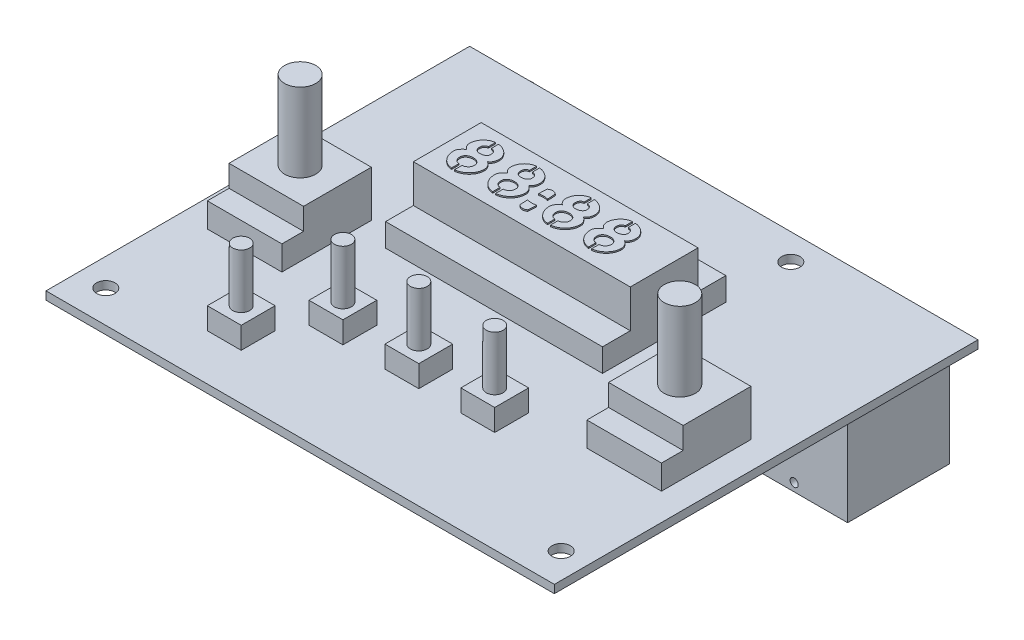
from build123d import *

# Parameters (mm, degrees)
SKETCH1_W                             = 95.25
SKETCH1_H                             = 79.375
BOSS_EXTRUDE1_DEPTH                   = 1.524
F_29_0_136_DIAMETER_HOLE1_D           = 3.4544
SKETCH4_W                             = 13.97
SKETCH4_H                             = 16.764
BOSS_EXTRUDE2_DEPTH                   = 4.572
SKETCH5_W                             = 13.97
SKETCH5_H                             = 12.7
BOSS_EXTRUDE3_DEPTH                   = 4.064
SKETCH8_W                             = 6.35
SKETCH8_H                             = 6.35
BOSS_EXTRUDE5_DEPTH                   = 4.064
SKETCH9_R                             = 1.5875
BOSS_EXTRUDE6_DEPTH                   = 10.16
SKETCH10_R                            = 2.921
BOSS_EXTRUDE7_DEPTH                   = 14.732
SKETCH11_W                            = 20.0152
SKETCH11_H                            = 21.336
BOSS_EXTRUDE8_DEPTH                   = 19.05
SKETCH12_R                            = 6.985
CUT_EXTRUDE1_DEPTH                    = 3.175
SKETCH14_W                            = 0.75565
SKETCH14_H                            = 79.375
F_53_0_0595_DIAMETER_HOLE1_AT_2_COUNT = 2
F_53_0_0595_DIAMETER_HOLE1_AT_2_PITCH = 17.4879
F_53_0_0595_DIAMETER_HOLE1_AT_3_COUNT = 2
F_53_0_0595_DIAMETER_HOLE1_AT_3_PITCH = 16.783370835
SKETCH15_W                            = 5.969
SKETCH15_H                            = 5.334
BOSS_EXTRUDE9_DEPTH                   = 13.97
SKETCH16_R                            = 2.54
SKETCH16_R_2                          = 1.778
BOSS_EXTRUDE10_DEPTH                  = 2.032
BOSS_EXTRUDE10_DRAFT                  = 9
SKETCH17_R                            = 1.778
CUT_EXTRUDE2_DEPTH                    = 12.7
SKETCH18_W                            = 40.64
SKETCH18_H                            = 23.114
BOSS_EXTRUDE11_DEPTH                  = 4.318
SKETCH19_W                            = 40.64
SKETCH19_H                            = 12.7
BOSS_EXTRUDE12_DEPTH                  = 7.112
SKETCH20_W                            = 33.02
SKETCH20_H                            = 2.410000006
BOSS_EXTRUDE13_DEPTH                  = 2.54
SKETCH21_W                            = 8.89
SKETCH21_H                            = 4.572
BOSS_EXTRUDE14_DEPTH                  = 4.826
SKETCH22_W                            = 8.89
SKETCH22_H                            = 2.032
BOSS_EXTRUDE15_DEPTH                  = 1.524
BOSS_EXTRUDE16_DEPTH                  = 0.254


with BuildPart() as part:
    # Sketch1 → Boss-Extrude1 (new body)
    with BuildSketch(Plane(origin=(0, 0, 0), x_dir=(1, 0, 0), z_dir=(0, 1, 0))):
        Rectangle(SKETCH1_W, SKETCH1_H)
    extrude(amount=BOSS_EXTRUDE1_DEPTH)

    # #29 (0.136) Diameter Hole1 (through all)
    with Locations(Plane(origin=(0, 1.524, 0), x_dir=(1, 0, 0), z_dir=(0, 1, 0))):
        with Locations((42.8498, -33.6423), (17.4498, 34.7853), (-25.8318, 22.2123), (-42.4688, -33.6423)):
            Hole(F_29_0_136_DIAMETER_HOLE1_D / 2)

    # Sketch4 → Boss-Extrude2 (add)
    with BuildSketch(Plane(origin=(0, 1.524, 0), x_dir=(1, 0, 0), z_dir=(0, 1, 0))):
        with Locations((35.56, -6.1595)):
            Rectangle(SKETCH4_W, SKETCH4_H)
        with Locations((-35.56, -6.1595)):
            Rectangle(SKETCH4_W, SKETCH4_H)
    extrude(amount=BOSS_EXTRUDE2_DEPTH)

    # Sketch5 → Boss-Extrude3 (add)
    with BuildSketch(Plane(origin=(0, 6.096, 0), x_dir=(1, 0, 0), z_dir=(0, 1, 0))):
        with Locations((-35.56, -4.1275)):
            Rectangle(SKETCH5_W, SKETCH5_H)
        with Locations((35.56, -4.1275)):
            Rectangle(SKETCH5_W, SKETCH5_H)
    extrude(amount=BOSS_EXTRUDE3_DEPTH)

    # Sketch8 → Boss-Extrude5 (add)
    with BuildSketch(Plane(origin=(0, 1.524, 0), x_dir=(1, 0, 0), z_dir=(0, 1, 0))):
        with Locations((-22.86, -27.8765)):
            Rectangle(SKETCH8_W, SKETCH8_H)
        with Locations((14.224, -17.4625)):
            Rectangle(SKETCH8_W, SKETCH8_H)
        with Locations((0, -17.4625)):
            Rectangle(SKETCH8_W, SKETCH8_H)
        with Locations((-14.224, -17.4625)):
            Rectangle(SKETCH8_W, SKETCH8_H)
    extrude(amount=BOSS_EXTRUDE5_DEPTH)

    # Sketch9 → Boss-Extrude6 (add)
    with BuildSketch(Plane(origin=(0, 5.588, 0), x_dir=(1, 0, 0), z_dir=(0, 1, 0))):
        with Locations((-13.942192497, -17.744307503)):
            Circle(SKETCH9_R)
        with Locations((0, -17.4625)):
            Circle(SKETCH9_R)
        with Locations((14.224, -17.4625)):
            Circle(SKETCH9_R)
        with Locations((-22.86, -27.8765)):
            Circle(SKETCH9_R)
    extrude(amount=BOSS_EXTRUDE6_DEPTH)

    # Sketch10 → Boss-Extrude7 (add)
    with BuildSketch(Plane(origin=(0, 10.16, 0), x_dir=(1, 0, 0), z_dir=(0, 1, 0))):
        with Locations((-35.56, -4.1275)):
            Circle(SKETCH10_R)
        with Locations((35.56, -4.1275)):
            Circle(SKETCH10_R)
    extrude(amount=BOSS_EXTRUDE7_DEPTH)

    # Sketch15 → Boss-Extrude9 (add)
    with BuildSketch(Plane(origin=(0, 0, -39.6875), x_dir=(-1, 0, 0), z_dir=(0, 0, -1))):
        with Locations((37.9095, -2.667)):
            Rectangle(SKETCH15_W, SKETCH15_H)
    extrude(amount=-BOSS_EXTRUDE9_DEPTH)


with BuildPart() as body_2:
    # Sketch11 → Boss-Extrude8 (new body)
    with BuildSketch(Plane(origin=(0, 0, -39.6875), x_dir=(-1, 0, 0), z_dir=(0, 0, -1))):
        with Locations((-32.2326, -10.668)):
            Rectangle(SKETCH11_W, SKETCH11_H)
    extrude(amount=-BOSS_EXTRUDE8_DEPTH)

    # Sketch12 → Cut-Extrude1 (cut)
    with BuildSketch(Plane(origin=(0, 0, -39.6875), x_dir=(-1, 0, 0), z_dir=(0, 0, -1))):
        with Locations((-32.2326, -10.541)):
            Circle(SKETCH12_R)
    extrude(amount=-CUT_EXTRUDE1_DEPTH, mode=Mode.SUBTRACT)

    # Sketch14 → #53 (0.0595) Diameter Hole1 (revolve, cut)
    with BuildSketch(Plane(origin=(40.97655, -5.492678114, -39.6875), x_dir=(0, 1, 0), z_dir=(1, 0, 0))):
        with Locations((0.377825, 39.6875)):
            Rectangle(SKETCH14_W, SKETCH14_H)
    f_53_0_0595_diameter_hole1 = revolve(axis=Axis((40.97655, -5.492678114, -46.0375), (0, 0, 1)), mode=Mode.SUBTRACT)

    # #53 (0.0595) Diameter Hole1 at 2: #53 (0.0595) Diameter Hole1 ×2
    with Locations(*[(-i * F_53_0_0595_DIAMETER_HOLE1_AT_2_PITCH, 0, 0) for i in range(1, F_53_0_0595_DIAMETER_HOLE1_AT_2_COUNT)]):
        add(f_53_0_0595_diameter_hole1, mode=Mode.SUBTRACT)

    # #53 (0.0595) Diameter Hole1 at 3: #53 (0.0595) Diameter Hole1 ×2
    with Locations(*[Vector(-0.5209889053752342, -0.8535634484184028, 0) * (i * F_53_0_0595_DIAMETER_HOLE1_AT_3_PITCH) for i in range(1, F_53_0_0595_DIAMETER_HOLE1_AT_3_COUNT)]):
        add(f_53_0_0595_diameter_hole1, mode=Mode.SUBTRACT)


with BuildPart() as boss_extrude10_tool:
    # Sketch16 → Boss-Extrude10 (with draft: the straight prism first)
    with BuildSketch(Plane(origin=(0, 0, -39.6875), x_dir=(-1, 0, 0), z_dir=(0, 0, -1))):
        with Locations((37.9095, -2.667)):
            Circle(SKETCH16_R)
        with Locations((37.9095, -2.667)):
            Circle(SKETCH16_R_2, mode=Mode.SUBTRACT)
    extrude(amount=BOSS_EXTRUDE10_DEPTH)
    # Boss-Extrude10: the draft: its side faces are tilted about the plane it starts from
    boss_extrude10_sides = [boss_extrude10_tool.faces().sort_by_distance(p)[0] for p in [
        (-35.3695, -2.667, -40.7035),
        (-36.1315, -2.667, -40.7035),
    ]]
    draft(boss_extrude10_sides, Plane(origin=(0, 0, -39.6875), x_dir=(-1, 0, 0), z_dir=(0, 0, -1)), BOSS_EXTRUDE10_DRAFT)


with BuildPart() as part_1:
    add(part.part)

    # Boss-Extrude10: add boss_extrude10_tool
    add(boss_extrude10_tool.part)

    # Sketch17 → Cut-Extrude2 (cut)
    with BuildSketch(Plane(origin=(0, 0, -39.6875), x_dir=(-1, 0, 0), z_dir=(0, 0, -1))):
        with Locations((37.9095, -2.667)):
            Circle(SKETCH17_R)
    extrude(amount=-CUT_EXTRUDE2_DEPTH, mode=Mode.SUBTRACT)

    # Sketch18 → Boss-Extrude11 (add)
    with BuildSketch(Plane(origin=(0, 1.524, 0), x_dir=(1, 0, 0), z_dir=(0, 1, 0))):
        with Locations((-2.413, 10.6045)):
            Rectangle(SKETCH18_W, SKETCH18_H)
    extrude(amount=BOSS_EXTRUDE11_DEPTH)

    # Sketch19 → Boss-Extrude12 (add)
    with BuildSketch(Plane(origin=(0, 5.842, 0), x_dir=(1, 0, 0), z_dir=(0, 1, 0))):
        with Locations((-2.413, 10.6045)):
            Rectangle(SKETCH19_W, SKETCH19_H)
    extrude(amount=BOSS_EXTRUDE12_DEPTH)

    # Sketch20 → Boss-Extrude13 (add)
    with BuildSketch(Plane.XZ):
        with Locations((1.143, 34.672499997)):
            Rectangle(SKETCH20_W, SKETCH20_H)
    extrude(amount=BOSS_EXTRUDE13_DEPTH)

    # Sketch21 → Boss-Extrude14 (add)
    with BuildSketch(Plane.XZ):
        with Locations((-1.016, -37.4015)):
            Rectangle(SKETCH21_W, SKETCH21_H)
    extrude(amount=BOSS_EXTRUDE14_DEPTH)

    # Sketch22 → Boss-Extrude15 (add)
    with BuildSketch(Plane(origin=(0, 0, -39.6875), x_dir=(-1, 0, 0), z_dir=(0, 0, -1))):
        with Locations((1.016, -2.413)):
            Rectangle(SKETCH22_W, SKETCH22_H)
    extrude(amount=BOSS_EXTRUDE15_DEPTH)

    # Sketch23 → Boss-Extrude16 (add)
    with BuildSketch(Plane(origin=(0, 12.954, 0), x_dir=(1, 0, 0), z_dir=(0, 1, 0))):
        with BuildLine():
            add(Edge.make_bspline(
                [(-14.59275285, 9.458275193), (-14.5958246, 9.535342211), (-14.601907288, 9.687950501), (-14.659415351, 9.91079508), (-14.748348029, 10.124090882), (-14.874410596, 10.32311803), (-15.020929076, 10.508695552), (-15.183091741, 10.678410699), (-15.35465531, 10.834358631), (-15.481467044, 10.921313393), (-15.544721308, 10.96468682)],
                knots=[0, 0, 0, 0, 0.995318931, 1.970932874, 2.958210881, 3.97438322, 5.007739601, 6.01292083, 7.008835956, 8, 8, 8, 8], degree=3))
            add(Edge.make_bspline(
                [(-15.544721308, 10.96468682), (-15.488142585, 10.998844815), (-15.375435373, 11.066888986), (-15.230415733, 11.202781299), (-15.103788521, 11.359908716), (-15.003931699, 11.541267209), (-14.922639254, 11.733648116), (-14.864933941, 11.932678891), (-14.82849111, 12.134423619), (-14.823604093, 12.270440932), (-14.821155539, 12.338590016)],
                knots=[0, 0, 0, 0, 0.973206171, 1.938667874, 2.915384234, 3.941165853, 4.983177624, 5.993087763, 6.994471904, 8, 8, 8, 8], degree=3))
            Line((-14.821155539, 12.338590016), (-14.821155539, 12.446688998))
            add(Edge.make_bspline(
                [(-14.821155539, 12.446688998), (-14.8239245, 12.525894752), (-14.829396746, 12.682427594), (-14.870279656, 12.912204597), (-14.938584682, 13.132604658), (-15.035852874, 13.341299205), (-15.152985917, 13.539346621), (-15.285787755, 13.727206328), (-15.436361413, 13.902411714), (-15.604371037, 14.063166722), (-15.783351949, 14.214594497), (-15.97747972, 14.347834251), (-16.18258586, 14.468101734), (-16.399438047, 14.568838363), (-16.621674946, 14.656403694), (-16.847259038, 14.725922398), (-17.074233765, 14.780051383), (-17.227575784, 14.799492513), (-17.303945071, 14.809174825)],
                knots=[0, 0, 0, 0, 1.017484137, 2.010834781, 2.988792481, 3.974674747, 4.962252912, 5.942460988, 6.927522522, 7.925774482, 8.927930235, 9.936881282, 10.947572307, 11.97991419, 13.006240961, 14.014943195, 15.01137748, 16, 16, 16, 16], degree=3))
            add(Edge.make_bspline(
                [(-17.303945071, 14.809174825), (-17.318183916, 14.807140704), (-17.346661604, 14.803072463), (-17.350729846, 14.774594774), (-17.352763966, 14.760355929)],
                knots=[0, 0, 0, 0, 1, 2, 2, 2, 2], degree=3))
            add(Edge.make_bspline(
                [(-17.352763966, 14.760355929), (-17.349422635, 14.655752491), (-17.342759609, 14.447160362), (-17.341291256, 14.238467072), (-17.340559243, 14.13442795)],
                knots=[0, 0, 0, 0, 1.002947133, 2, 2, 2, 2], degree=3))
            add(Edge.make_bspline(
                [(-17.340559243, 14.13442795), (-17.340559243, 14.032721918), (-17.340559243, 13.827566323), (-17.340559243, 13.622410727), (-17.340559243, 13.518961163)],
                knots=[0, 0, 0, 0, 0.991501416, 2, 2, 2, 2], degree=3))
            add(Edge.make_bspline(
                [(-17.340559243, 13.518961163), (-17.338353102, 13.505447516), (-17.333842295, 13.477816706), (-17.305977207, 13.473891348), (-17.291740347, 13.4718858)],
                knots=[0, 0, 0, 0, 0.978157849, 2, 2, 2, 2], degree=3))
            add(Edge.make_bspline(
                [(-17.291740347, 13.4718858), (-17.234917586, 13.463963561), (-17.121890648, 13.448205326), (-16.960820838, 13.3898859), (-16.80876771, 13.31111665), (-16.67032309, 13.20905014), (-16.550416625, 13.087064302), (-16.462657026, 12.942454003), (-16.410145833, 12.778563696), (-16.403984681, 12.663280477), (-16.400795508, 12.603606876)],
                knots=[0, 0, 0, 0, 1.005745738, 2.000542698, 2.99182103, 4.007011567, 5.011044689, 5.977873494, 6.953294593, 8, 8, 8, 8], degree=3))
            Line((-16.400795508, 12.603606876), (-16.400795508, 12.542583257))
            add(Edge.make_bspline(
                [(-16.400795508, 12.542583257), (-16.400250981, 12.533864088), (-16.399014446, 12.514064215), (-16.39619471, 12.483144513), (-16.389685936, 12.452121369), (-16.388933033, 12.431605497), (-16.388590784, 12.422279551)],
                knots=[0, 0, 0, 0, 0.866411576, 1.967485452, 3.076075278, 4, 4, 4, 4], degree=3))
            add(Edge.make_bspline(
                [(-16.388590784, 12.422279551), (-16.389969507, 12.389042581), (-16.392677943, 12.323750134), (-16.413034892, 12.228345167), (-16.443230373, 12.137076891), (-16.505376931, 12.026230039), (-16.603890919, 11.900325399), (-16.754483001, 11.778587549), (-16.927813235, 11.683112936), (-17.115240372, 11.610421598), (-17.311260988, 11.566253627), (-17.443225311, 11.559202103), (-17.507938312, 11.555744159)],
                knots=[0, 0, 0, 0, 0.637370974, 1.252084947, 1.865887407, 2.47480542, 3.682072335, 4.910335882, 6.163867148, 7.466846277, 8.757785619, 10, 10, 10, 10], degree=3))
            Line((-17.507938312, 11.555744159), (-17.701470361, 11.555744159))
            add(Edge.make_bspline(
                [(-17.701470361, 11.555744159), (-17.761056063, 11.559402073), (-17.880456769, 11.566731977), (-18.053629574, 11.616528895), (-18.212993498, 11.697684451), (-18.355032729, 11.80416109), (-18.474604521, 11.934204901), (-18.567233385, 12.082463334), (-18.631247306, 12.24711465), (-18.637887614, 12.363583391), (-18.641234096, 12.422279551)],
                knots=[0, 0, 0, 0, 1.013450506, 2.030801042, 3.03907653, 4.041760303, 5.035530285, 6.026047973, 7.005197428, 8, 8, 8, 8], degree=3))
            Line((-18.641234096, 12.422279551), (-18.641234096, 12.603606876))
            add(Edge.make_bspline(
                [(-18.641234096, 12.603606876), (-18.639645093, 12.654985975), (-18.636518045, 12.756096471), (-18.598974817, 12.902776884), (-18.543101979, 13.042358356), (-18.465586332, 13.172278948), (-18.367822656, 13.285938434), (-18.249319317, 13.373625191), (-18.11441684, 13.435265096), (-18.016492794, 13.45142759), (-17.966487222, 13.459681076)],
                knots=[0, 0, 0, 0, 1.030008905, 2.026985943, 3.022320288, 4.043687467, 5.053237222, 6.013141971, 6.985397581, 8, 8, 8, 8], degree=3))
            add(Edge.make_bspline(
                [(-17.966487222, 13.459681076), (-17.952250361, 13.461686624), (-17.924385274, 13.465611982), (-17.919874467, 13.493242792), (-17.917668326, 13.506756439)],
                knots=[0, 0, 0, 0, 1.021842151, 2, 2, 2, 2], degree=3))
            add(Edge.make_bspline(
                [(-17.917668326, 13.506756439), (-17.914169391, 13.561367895), (-17.907473605, 13.665875865), (-17.907293246, 13.770594907), (-17.907207134, 13.820592195)],
                knots=[0, 0, 0, 0, 1.045115631, 2, 2, 2, 2], degree=3))
            add(Edge.make_bspline(
                [(-17.907207134, 13.820592195), (-17.907207134, 13.872898154), (-17.907207134, 13.977510072), (-17.907207134, 14.082121991), (-17.907207134, 14.13442795)],
                knots=[0, 0, 0, 0, 1, 2, 2, 2, 2], degree=3))
            add(Edge.make_bspline(
                [(-17.907207134, 14.13442795), (-17.90671813, 14.18382915), (-17.905728516, 14.28380379), (-17.902495609, 14.436089916), (-17.895726318, 14.591183988), (-17.895243673, 14.695837408), (-17.895002411, 14.748151205)],
                knots=[0, 0, 0, 0, 0.965744349, 1.954404832, 2.977454803, 4, 4, 4, 4], degree=3))
            add(Edge.make_bspline(
                [(-17.895002411, 14.748151205), (-17.897007959, 14.762388066), (-17.900933317, 14.790253153), (-17.928564127, 14.79476396), (-17.942077774, 14.796970101)],
                knots=[0, 0, 0, 0, 1.021842151, 2, 2, 2, 2], degree=3))
            add(Edge.make_bspline(
                [(-17.942077774, 14.796970101), (-18.013798664, 14.789168238), (-18.156770398, 14.773615643), (-18.36701708, 14.723514977), (-18.571581628, 14.653245781), (-18.770089233, 14.564648838), (-18.958689867, 14.458051783), (-19.138681042, 14.339337912), (-19.305426231, 14.20424449), (-19.462648362, 14.05792206), (-19.608182956, 13.899856308), (-19.736933006, 13.726548572), (-19.856074737, 13.544812961), (-19.958504553, 13.351531066), (-20.043822774, 13.150748487), (-20.112503603, 12.945313474), (-20.160488286, 12.734392292), (-20.176313896, 12.591608644), (-20.184259894, 12.519917341)],
                knots=[0, 0, 0, 0, 1.001021632, 1.995482755, 2.99337639, 4.001271291, 5.009327732, 5.998667133, 6.991850302, 7.985394085, 8.979396645, 9.970446227, 10.980019879, 11.994516817, 13.003348289, 14.006319965, 14.998978368, 16, 16, 16, 16], degree=3))
            Line((-20.184259894, 12.519917341), (-20.196464618, 12.507712618))
            add(Edge.make_bspline(
                [(-20.196464618, 12.507712618), (-20.199810506, 12.490327159), (-20.206793455, 12.454043288), (-20.208026902, 12.417107872), (-20.208669341, 12.397870103)],
                knots=[0, 0, 0, 0, 0.958302254, 2, 2, 2, 2], degree=3))
            add(Edge.make_bspline(
                [(-20.208669341, 12.397870103), (-20.208669341, 12.381015961), (-20.208669341, 12.344982966), (-20.208669341, 12.308949972), (-20.208669341, 12.289771121)],
                knots=[0, 0, 0, 0, 0.935483871, 2, 2, 2, 2], degree=3))
            add(Edge.make_bspline(
                [(-20.208669341, 12.289771121), (-20.206528727, 12.22562717), (-20.202247588, 12.097341909), (-20.160954853, 11.907970565), (-20.100236811, 11.720729723), (-20.013377968, 11.540069363), (-19.906744148, 11.370999115), (-19.78285692, 11.218698933), (-19.644054069, 11.084336806), (-19.53797087, 11.012628083), (-19.485103572, 10.976891543)],
                knots=[0, 0, 0, 0, 0.985024158, 1.970007775, 2.967600018, 4.006910369, 5.043258017, 6.034223535, 7.020341646, 8, 8, 8, 8], degree=3))
            add(Edge.make_bspline(
                [(-19.485103572, 10.976891543), (-19.547925168, 10.93123187), (-19.674092358, 10.839531675), (-19.852519213, 10.686222048), (-20.017478542, 10.515016648), (-20.174955049, 10.335774348), (-20.308898622, 10.1409276), (-20.405427994, 9.928957023), (-20.462405878, 9.703606729), (-20.469902536, 9.548675718), (-20.473686202, 9.470479917)],
                knots=[0, 0, 0, 0, 0.993652422, 1.995592932, 3.005397526, 4.033954309, 5.046794601, 6.018720914, 7.000021345, 8, 8, 8, 8], degree=3))
            add(Edge.make_bspline(
                [(-20.473686202, 9.470479917), (-20.473158629, 9.450724983), (-20.472133763, 9.412348944), (-20.469702226, 9.355076607), (-20.459472462, 9.298380219), (-20.452746923, 9.260090172), (-20.449276754, 9.240333696)],
                knots=[0, 0, 0, 0, 1.023069621, 1.987420469, 2.961571409, 4, 4, 4, 4], degree=3))
            Line((-20.449276754, 9.240333696), (-20.449276754, 9.25253842))
            add(Edge.make_bspline(
                [(-20.449276754, 9.25253842), (-20.443514339, 9.170366071), (-20.43198951, 9.006021373), (-20.382331657, 8.763096319), (-20.314587415, 8.522578183), (-20.224329902, 8.286723099), (-20.11307083, 8.059718928), (-19.98447706, 7.844048278), (-19.842331886, 7.639171106), (-19.681006244, 7.449111589), (-19.505657309, 7.27337224), (-19.315967536, 7.113674148), (-19.113309577, 6.970293269), (-18.898086179, 6.844576307), (-18.670920154, 6.741537351), (-18.435259689, 6.662204406), (-18.19101118, 6.611130124), (-18.025401657, 6.597182584), (-17.942077774, 6.590165094)],
                knots=[0, 0, 0, 0, 0.991093162, 1.982186323, 2.979193569, 3.998313328, 5.018802209, 6.019928527, 7.019953186, 8.018310808, 9.018065988, 10.006560611, 11.000861602, 12.004480536, 13.003721054, 13.999745058, 14.993602505, 16, 16, 16, 16], degree=3))
            add(Edge.make_bspline(
                [(-17.942077774, 6.590165094), (-17.928565401, 6.592344509), (-17.901540655, 6.596703339), (-17.897181826, 6.623728085), (-17.895002411, 6.637240458)],
                knots=[0, 0, 0, 0, 1, 2, 2, 2, 2], degree=3))
            Line((-17.895002411, 6.637240458), (-17.895002411, 7.277116692))
            add(Edge.make_bspline(
                [(-17.895002411, 7.277116692), (-17.895211762, 7.332336936), (-17.895621747, 7.440478166), (-17.902628482, 7.601961098), (-17.905782165, 7.763549467), (-17.90672712, 7.87224127), (-17.907207134, 7.927454119)],
                knots=[0, 0, 0, 0, 1.018600088, 1.99478774, 2.981399912, 4, 4, 4, 4], degree=3))
            add(Edge.make_bspline(
                [(-17.907207134, 7.927454119), (-17.909212683, 7.941690979), (-17.913138041, 7.969556066), (-17.940768851, 7.974066874), (-17.954282498, 7.976273014)],
                knots=[0, 0, 0, 0, 1.021842151, 2, 2, 2, 2], degree=3))
            add(Edge.make_bspline(
                [(-17.954282498, 7.976273014), (-18.020564007, 7.980444737), (-18.150273562, 7.988608586), (-18.332626027, 8.058503593), (-18.489278479, 8.166459039), (-18.628420501, 8.295935569), (-18.738732643, 8.452014474), (-18.821082747, 8.624491382), (-18.870689668, 8.809911103), (-18.87813759, 8.93668198), (-18.881841508, 8.999726284)],
                knots=[0, 0, 0, 0, 1.03923749, 2.033735126, 3.022001828, 4.017254619, 5.006070206, 6.007343738, 7.009034032, 8, 8, 8, 8], degree=3))
            Line((-18.881841508, 8.999726284), (-18.881841508, 9.072954627))
            add(Edge.make_bspline(
                [(-18.881841508, 9.072954627), (-18.882041678, 9.081150518), (-18.882432121, 9.097137049), (-18.889619503, 9.120353269), (-18.89254183, 9.14436645), (-18.89354603, 9.160708656), (-18.894046232, 9.168848885)],
                knots=[0, 0, 0, 0, 1.010575764, 1.971182807, 2.989424236, 4, 4, 4, 4], degree=3))
            add(Edge.make_bspline(
                [(-18.894046232, 9.168848885), (-18.892849636, 9.208488542), (-18.890509184, 9.286020746), (-18.867780736, 9.399248091), (-18.836015675, 9.507689361), (-18.771486716, 9.642858438), (-18.665574392, 9.798935747), (-18.501397626, 9.957836715), (-18.309398837, 10.087278791), (-18.095671035, 10.179792093), (-17.871195813, 10.242626837), (-17.716985749, 10.249776958), (-17.640446742, 10.253325774)],
                knots=[0, 0, 0, 0, 0.64801719, 1.26747319, 1.884367176, 2.492990243, 3.712019454, 4.949835234, 6.211045677, 7.480267519, 8.749382399, 10, 10, 10, 10], degree=3))
            Line((-17.640446742, 10.253325774), (-17.556757207, 10.253325774))
            add(Edge.make_bspline(
                [(-17.556757207, 10.253325774), (-17.5451268, 10.253779885), (-17.522977751, 10.254644698), (-17.490340558, 10.257967399), (-17.458221098, 10.265021943), (-17.435917997, 10.265355813), (-17.424248777, 10.265530498)],
                knots=[0, 0, 0, 0, 1.048304645, 1.996400496, 2.951695355, 4, 4, 4, 4], degree=3))
            add(Edge.make_bspline(
                [(-17.424248777, 10.265530498), (-17.347723276, 10.261905963), (-17.192414077, 10.254549937), (-16.965143277, 10.191772377), (-16.7491203, 10.100271227), (-16.554512404, 9.974930271), (-16.386289555, 9.81998795), (-16.283129606, 9.659668022), (-16.21608135, 9.52200222), (-16.184582859, 9.409071656), (-16.161995691, 9.291216212), (-16.159645421, 9.210228897), (-16.158444563, 9.168848885)],
                knots=[0, 0, 0, 0, 1.234039438, 2.504494217, 3.782693636, 5.011688637, 6.226839427, 7.445285228, 8.066822692, 8.693513545, 9.332458123, 10, 10, 10, 10], degree=3))
            add(Edge.make_bspline(
                [(-16.158444563, 9.168848885), (-16.158732738, 9.16009277), (-16.159332964, 9.141855086), (-16.166019388, 9.114983933), (-16.169095375, 9.087549383), (-16.170143553, 9.069472026), (-16.170649287, 9.060749903)],
                knots=[0, 0, 0, 0, 0.962594109, 2.00494014, 3.037405891, 4, 4, 4, 4], degree=3))
            add(Edge.make_bspline(
                [(-16.170649287, 9.060749903), (-16.176456254, 8.988764192), (-16.187835496, 8.847702111), (-16.254792789, 8.645993486), (-16.361861683, 8.463248504), (-16.505050683, 8.303042663), (-16.672761259, 8.167880265), (-16.857863247, 8.064162756), (-17.056702028, 7.990527824), (-17.196405476, 7.972978055), (-17.2673309, 7.964068291)],
                knots=[0, 0, 0, 0, 1.019336045, 1.997475105, 2.978067161, 3.998033706, 5.021973388, 6.012760731, 6.991107325, 8, 8, 8, 8], degree=3))
            add(Edge.make_bspline(
                [(-17.2673309, 7.964068291), (-17.281569744, 7.96203417), (-17.310047433, 7.957965929), (-17.314115674, 7.92948824), (-17.316149795, 7.915249395)],
                knots=[0, 0, 0, 0, 1, 2, 2, 2, 2], degree=3))
            add(Edge.make_bspline(
                [(-17.316149795, 7.915249395), (-17.316368341, 7.860029425), (-17.316798634, 7.751307814), (-17.323707649, 7.589821897), (-17.326956213, 7.428236126), (-17.32788181, 7.320124994), (-17.328354519, 7.264911969)],
                knots=[0, 0, 0, 0, 1.018600902, 2.005505097, 2.981399098, 4, 4, 4, 4], degree=3))
            add(Edge.make_bspline(
                [(-17.328354519, 7.264911969), (-17.328354519, 7.211443655), (-17.328354519, 7.102763495), (-17.328354519, 6.994083335), (-17.328354519, 6.938871489)],
                knots=[0, 0, 0, 0, 0.983957219, 2, 2, 2, 2], degree=3))
            add(Edge.make_bspline(
                [(-17.328354519, 6.938871489), (-17.329121302, 6.885969599), (-17.330689489, 6.777777375), (-17.33722126, 6.669770272), (-17.340559243, 6.614574542)],
                knots=[0, 0, 0, 0, 0.977924061, 2, 2, 2, 2], degree=3))
            add(Edge.make_bspline(
                [(-17.340559243, 6.614574542), (-17.338525122, 6.600335697), (-17.334456881, 6.571858009), (-17.305979192, 6.567789767), (-17.291740347, 6.565755647)],
                knots=[0, 0, 0, 0, 1, 2, 2, 2, 2], degree=3))
            add(Edge.make_bspline(
                [(-17.291740347, 6.565755647), (-17.2077476, 6.575615799), (-17.039397296, 6.595378929), (-16.791948824, 6.657003491), (-16.547398429, 6.737250696), (-16.308594488, 6.840049108), (-16.077243736, 6.961123899), (-15.859101495, 7.101354724), (-15.653652646, 7.256718146), (-15.463752378, 7.430247956), (-15.287741848, 7.61712513), (-15.130738316, 7.819576364), (-14.988362926, 8.031829033), (-14.866965164, 8.257591691), (-14.762366827, 8.492734002), (-14.685220421, 8.738566631), (-14.628798007, 8.99231323), (-14.612969153, 9.165089725), (-14.604957574, 9.25253842)],
                knots=[0, 0, 0, 0, 0.984994069, 1.974266293, 2.96624927, 3.983093936, 5.001382152, 6.006877751, 7.002855415, 8.000490893, 9.002327637, 9.991715857, 10.983883914, 11.978270245, 12.976457716, 13.979233314, 14.977213824, 16, 16, 16, 16], degree=3))
            Line((-14.604957574, 9.25253842), (-14.604957574, 9.240333696))
            add(Edge.make_bspline(
                [(-14.604957574, 9.240333696), (-14.601626723, 9.259466271), (-14.59529535, 9.295833993), (-14.59357035, 9.332703337), (-14.59275285, 9.350176211)],
                knots=[0, 0, 0, 0, 1.052173348, 2, 2, 2, 2], degree=3))
            add(Edge.make_bspline(
                [(-14.59275285, 9.350176211), (-14.59275285, 9.367030353), (-14.59275285, 9.403063347), (-14.59275285, 9.439096341), (-14.59275285, 9.458275193)],
                knots=[0, 0, 0, 0, 0.935483871, 2, 2, 2, 2], degree=3))
        make_face()
        with BuildLine():
            add(Edge.make_bspline(
                [(-6.893315648, 9.458275193), (-6.896387399, 9.535342211), (-6.902470086, 9.687950501), (-6.959978149, 9.91079508), (-7.048910828, 10.124090882), (-7.174973394, 10.32311803), (-7.321491875, 10.508695552), (-7.48365454, 10.678410699), (-7.655218108, 10.834358631), (-7.782029842, 10.921313393), (-7.845284107, 10.96468682)],
                knots=[0, 0, 0, 0, 0.995318931, 1.970932874, 2.958210881, 3.97438322, 5.007739601, 6.01292083, 7.008835956, 8, 8, 8, 8], degree=3))
            add(Edge.make_bspline(
                [(-7.845284107, 10.96468682), (-7.788705383, 10.998844815), (-7.675998171, 11.066888986), (-7.530978532, 11.202781299), (-7.404351319, 11.359908716), (-7.304494498, 11.541267209), (-7.223202053, 11.733648116), (-7.16549674, 11.932678891), (-7.129053909, 12.134423619), (-7.124166891, 12.270440932), (-7.121718337, 12.338590016)],
                knots=[0, 0, 0, 0, 0.973206171, 1.938667874, 2.915384234, 3.941165853, 4.983177624, 5.993087763, 6.994471904, 8, 8, 8, 8], degree=3))
            Line((-7.121718337, 12.338590016), (-7.121718337, 12.446688998))
            add(Edge.make_bspline(
                [(-7.121718337, 12.446688998), (-7.124487298, 12.525894752), (-7.129959544, 12.682427594), (-7.170842454, 12.912204597), (-7.23914748, 13.132604658), (-7.336415673, 13.341299205), (-7.453548716, 13.539346621), (-7.586350553, 13.727206328), (-7.736924212, 13.902411714), (-7.904933835, 14.063166722), (-8.083914747, 14.214594497), (-8.278042518, 14.347834251), (-8.483148658, 14.468101734), (-8.700000845, 14.568838363), (-8.922237745, 14.656403694), (-9.147821837, 14.725922398), (-9.374796563, 14.780051383), (-9.528138582, 14.799492513), (-9.604507869, 14.809174825)],
                knots=[0, 0, 0, 0, 1.017484137, 2.010834781, 2.988792481, 3.974674747, 4.962252912, 5.942460988, 6.927522522, 7.925774482, 8.927930235, 9.936881282, 10.947572307, 11.97991419, 13.006240961, 14.014943195, 15.01137748, 16, 16, 16, 16], degree=3))
            add(Edge.make_bspline(
                [(-9.604507869, 14.809174825), (-9.618746714, 14.807140704), (-9.647224403, 14.803072463), (-9.651292644, 14.774594774), (-9.653326765, 14.760355929)],
                knots=[0, 0, 0, 0, 1, 2, 2, 2, 2], degree=3))
            add(Edge.make_bspline(
                [(-9.653326765, 14.760355929), (-9.649985433, 14.655752491), (-9.643322408, 14.447160362), (-9.641854054, 14.238467072), (-9.641122041, 14.13442795)],
                knots=[0, 0, 0, 0, 1.002947133, 2, 2, 2, 2], degree=3))
            add(Edge.make_bspline(
                [(-9.641122041, 14.13442795), (-9.641122041, 14.032721918), (-9.641122041, 13.827566323), (-9.641122041, 13.622410727), (-9.641122041, 13.518961163)],
                knots=[0, 0, 0, 0, 0.991501416, 2, 2, 2, 2], degree=3))
            add(Edge.make_bspline(
                [(-9.641122041, 13.518961163), (-9.6389159, 13.505447516), (-9.634405093, 13.477816706), (-9.606540006, 13.473891348), (-9.592303146, 13.4718858)],
                knots=[0, 0, 0, 0, 0.978157849, 2, 2, 2, 2], degree=3))
            add(Edge.make_bspline(
                [(-9.592303146, 13.4718858), (-9.535480384, 13.463963561), (-9.422453446, 13.448205326), (-9.261383636, 13.3898859), (-9.109330509, 13.31111665), (-8.970885888, 13.20905014), (-8.850979424, 13.087064302), (-8.763219824, 12.942454003), (-8.710708631, 12.778563696), (-8.704547479, 12.663280477), (-8.701358306, 12.603606876)],
                knots=[0, 0, 0, 0, 1.005745738, 2.000542698, 2.99182103, 4.007011567, 5.011044689, 5.977873494, 6.953294593, 8, 8, 8, 8], degree=3))
            Line((-8.701358306, 12.603606876), (-8.701358306, 12.542583257))
            add(Edge.make_bspline(
                [(-8.701358306, 12.542583257), (-8.70081378, 12.533864088), (-8.699577245, 12.514064215), (-8.696757509, 12.483144513), (-8.690248735, 12.452121369), (-8.689495831, 12.431605497), (-8.689153582, 12.422279551)],
                knots=[0, 0, 0, 0, 0.866411576, 1.967485452, 3.076075278, 4, 4, 4, 4], degree=3))
            add(Edge.make_bspline(
                [(-8.689153582, 12.422279551), (-8.690532306, 12.389042581), (-8.693240742, 12.323750134), (-8.713597691, 12.228345167), (-8.743793171, 12.137076891), (-8.805939729, 12.026230039), (-8.904453717, 11.900325399), (-9.0550458, 11.778587549), (-9.228376033, 11.683112936), (-9.41580317, 11.610421598), (-9.611823786, 11.566253627), (-9.743788109, 11.559202103), (-9.80850111, 11.555744159)],
                knots=[0, 0, 0, 0, 0.637370974, 1.252084947, 1.865887407, 2.47480542, 3.682072335, 4.910335882, 6.163867148, 7.466846277, 8.757785619, 10, 10, 10, 10], degree=3))
            Line((-9.80850111, 11.555744159), (-10.00203316, 11.555744159))
            add(Edge.make_bspline(
                [(-10.00203316, 11.555744159), (-10.061618861, 11.559402073), (-10.181019567, 11.566731977), (-10.354192372, 11.616528895), (-10.513556296, 11.697684451), (-10.655595527, 11.80416109), (-10.77516732, 11.934204901), (-10.867796183, 12.082463334), (-10.931810105, 12.24711465), (-10.938450412, 12.363583391), (-10.941796894, 12.422279551)],
                knots=[0, 0, 0, 0, 1.013450506, 2.030801042, 3.03907653, 4.041760303, 5.035530285, 6.026047973, 7.005197428, 8, 8, 8, 8], degree=3))
            Line((-10.941796894, 12.422279551), (-10.941796894, 12.603606876))
            add(Edge.make_bspline(
                [(-10.941796894, 12.603606876), (-10.940207891, 12.654985975), (-10.937080844, 12.756096471), (-10.899537615, 12.902776884), (-10.843664777, 13.042358356), (-10.76614913, 13.172278948), (-10.668385454, 13.285938434), (-10.549882115, 13.373625191), (-10.414979639, 13.435265096), (-10.317055593, 13.45142759), (-10.26705002, 13.459681076)],
                knots=[0, 0, 0, 0, 1.030008905, 2.026985943, 3.022320288, 4.043687467, 5.053237222, 6.013141971, 6.985397581, 8, 8, 8, 8], degree=3))
            add(Edge.make_bspline(
                [(-10.26705002, 13.459681076), (-10.25281316, 13.461686624), (-10.224948073, 13.465611982), (-10.220437265, 13.493242792), (-10.218231125, 13.506756439)],
                knots=[0, 0, 0, 0, 1.021842151, 2, 2, 2, 2], degree=3))
            add(Edge.make_bspline(
                [(-10.218231125, 13.506756439), (-10.214732189, 13.561367895), (-10.208036404, 13.665875865), (-10.207856044, 13.770594907), (-10.207769933, 13.820592195)],
                knots=[0, 0, 0, 0, 1.045115631, 2, 2, 2, 2], degree=3))
            add(Edge.make_bspline(
                [(-10.207769933, 13.820592195), (-10.207769933, 13.872898154), (-10.207769933, 13.977510072), (-10.207769933, 14.082121991), (-10.207769933, 14.13442795)],
                knots=[0, 0, 0, 0, 1, 2, 2, 2, 2], degree=3))
            add(Edge.make_bspline(
                [(-10.207769933, 14.13442795), (-10.207280928, 14.18382915), (-10.206291314, 14.28380379), (-10.203058407, 14.436089916), (-10.196289116, 14.591183988), (-10.195806472, 14.695837408), (-10.195565209, 14.748151205)],
                knots=[0, 0, 0, 0, 0.965744349, 1.954404832, 2.977454803, 4, 4, 4, 4], degree=3))
            add(Edge.make_bspline(
                [(-10.195565209, 14.748151205), (-10.197570757, 14.762388066), (-10.201496115, 14.790253153), (-10.229126925, 14.79476396), (-10.242640572, 14.796970101)],
                knots=[0, 0, 0, 0, 1.021842151, 2, 2, 2, 2], degree=3))
            add(Edge.make_bspline(
                [(-10.242640572, 14.796970101), (-10.314361462, 14.789168238), (-10.457333196, 14.773615643), (-10.667579879, 14.723514977), (-10.872144426, 14.653245781), (-11.070652031, 14.564648838), (-11.259252665, 14.458051783), (-11.43924384, 14.339337912), (-11.60598903, 14.20424449), (-11.76321116, 14.05792206), (-11.908745755, 13.899856308), (-12.037495804, 13.726548572), (-12.156637535, 13.544812961), (-12.259067351, 13.351531066), (-12.344385572, 13.150748487), (-12.413066401, 12.945313474), (-12.461051084, 12.734392292), (-12.476876694, 12.591608644), (-12.484822692, 12.519917341)],
                knots=[0, 0, 0, 0, 1.001021632, 1.995482755, 2.99337639, 4.001271291, 5.009327732, 5.998667133, 6.991850302, 7.985394085, 8.979396645, 9.970446227, 10.980019879, 11.994516817, 13.003348289, 14.006319965, 14.998978368, 16, 16, 16, 16], degree=3))
            Line((-12.484822692, 12.519917341), (-12.497027416, 12.507712618))
            add(Edge.make_bspline(
                [(-12.497027416, 12.507712618), (-12.500373304, 12.490327159), (-12.507356253, 12.454043288), (-12.5085897, 12.417107872), (-12.50923214, 12.397870103)],
                knots=[0, 0, 0, 0, 0.958302254, 2, 2, 2, 2], degree=3))
            add(Edge.make_bspline(
                [(-12.50923214, 12.397870103), (-12.50923214, 12.381015961), (-12.50923214, 12.344982966), (-12.50923214, 12.308949972), (-12.50923214, 12.289771121)],
                knots=[0, 0, 0, 0, 0.935483871, 2, 2, 2, 2], degree=3))
            add(Edge.make_bspline(
                [(-12.50923214, 12.289771121), (-12.507091526, 12.22562717), (-12.502810386, 12.097341909), (-12.461517652, 11.907970565), (-12.400799609, 11.720729723), (-12.313940767, 11.540069363), (-12.207306946, 11.370999115), (-12.083419719, 11.218698933), (-11.944616867, 11.084336806), (-11.838533669, 11.012628083), (-11.78566637, 10.976891543)],
                knots=[0, 0, 0, 0, 0.985024158, 1.970007775, 2.967600018, 4.006910369, 5.043258017, 6.034223535, 7.020341646, 8, 8, 8, 8], degree=3))
            add(Edge.make_bspline(
                [(-11.78566637, 10.976891543), (-11.848487967, 10.93123187), (-11.974655157, 10.839531675), (-12.153082011, 10.686222048), (-12.31804134, 10.515016648), (-12.475517848, 10.335774348), (-12.60946142, 10.1409276), (-12.705990792, 9.928957023), (-12.762968676, 9.703606729), (-12.770465334, 9.548675718), (-12.774249, 9.470479917)],
                knots=[0, 0, 0, 0, 0.993652422, 1.995592932, 3.005397526, 4.033954309, 5.046794601, 6.018720914, 7.000021345, 8, 8, 8, 8], degree=3))
            add(Edge.make_bspline(
                [(-12.774249, 9.470479917), (-12.773721427, 9.450724983), (-12.772696562, 9.412348944), (-12.770265024, 9.355076607), (-12.76003526, 9.298380219), (-12.753309721, 9.260090172), (-12.749839552, 9.240333696)],
                knots=[0, 0, 0, 0, 1.023069621, 1.987420469, 2.961571409, 4, 4, 4, 4], degree=3))
            Line((-12.749839552, 9.240333696), (-12.749839552, 9.25253842))
            add(Edge.make_bspline(
                [(-12.749839552, 9.25253842), (-12.744077138, 9.170366071), (-12.732552309, 9.006021373), (-12.682894456, 8.763096319), (-12.615150213, 8.522578183), (-12.5248927, 8.286723099), (-12.413633629, 8.059718928), (-12.285039858, 7.844048278), (-12.142894685, 7.639171106), (-11.981569043, 7.449111589), (-11.806220108, 7.27337224), (-11.616530334, 7.113674148), (-11.413872375, 6.970293269), (-11.198648977, 6.844576307), (-10.971482952, 6.741537351), (-10.735822487, 6.662204406), (-10.491573978, 6.611130124), (-10.325964455, 6.597182584), (-10.242640572, 6.590165094)],
                knots=[0, 0, 0, 0, 0.991093162, 1.982186323, 2.979193569, 3.998313328, 5.018802209, 6.019928527, 7.019953186, 8.018310808, 9.018065988, 10.006560611, 11.000861602, 12.004480536, 13.003721054, 13.999745058, 14.993602505, 16, 16, 16, 16], degree=3))
            add(Edge.make_bspline(
                [(-10.242640572, 6.590165094), (-10.229128199, 6.592344509), (-10.202103454, 6.596703339), (-10.197744624, 6.623728085), (-10.195565209, 6.637240458)],
                knots=[0, 0, 0, 0, 1, 2, 2, 2, 2], degree=3))
            Line((-10.195565209, 6.637240458), (-10.195565209, 7.277116692))
            add(Edge.make_bspline(
                [(-10.195565209, 7.277116692), (-10.19577456, 7.332336936), (-10.196184545, 7.440478166), (-10.20319128, 7.601961098), (-10.206344964, 7.763549467), (-10.207289918, 7.87224127), (-10.207769933, 7.927454119)],
                knots=[0, 0, 0, 0, 1.018600088, 1.99478774, 2.981399912, 4, 4, 4, 4], degree=3))
            add(Edge.make_bspline(
                [(-10.207769933, 7.927454119), (-10.209775481, 7.941690979), (-10.213700839, 7.969556066), (-10.241331649, 7.974066874), (-10.254845296, 7.976273014)],
                knots=[0, 0, 0, 0, 1.021842151, 2, 2, 2, 2], degree=3))
            add(Edge.make_bspline(
                [(-10.254845296, 7.976273014), (-10.321126805, 7.980444737), (-10.450836361, 7.988608586), (-10.633188826, 8.058503593), (-10.789841277, 8.166459039), (-10.928983299, 8.295935569), (-11.039295442, 8.452014474), (-11.121645545, 8.624491382), (-11.171252466, 8.809911103), (-11.178700388, 8.93668198), (-11.182404307, 8.999726284)],
                knots=[0, 0, 0, 0, 1.03923749, 2.033735126, 3.022001828, 4.017254619, 5.006070206, 6.007343738, 7.009034032, 8, 8, 8, 8], degree=3))
            Line((-11.182404307, 8.999726284), (-11.182404307, 9.072954627))
            add(Edge.make_bspline(
                [(-11.182404307, 9.072954627), (-11.182604477, 9.081150518), (-11.182994919, 9.097137049), (-11.190182301, 9.120353269), (-11.193104629, 9.14436645), (-11.194108828, 9.160708656), (-11.194609031, 9.168848885)],
                knots=[0, 0, 0, 0, 1.010575764, 1.971182807, 2.989424236, 4, 4, 4, 4], degree=3))
            add(Edge.make_bspline(
                [(-11.194609031, 9.168848885), (-11.193412435, 9.208488542), (-11.191071982, 9.286020746), (-11.168343534, 9.399248091), (-11.136578473, 9.507689361), (-11.072049515, 9.642858438), (-10.96613719, 9.798935747), (-10.801960424, 9.957836715), (-10.609961636, 10.087278791), (-10.396233833, 10.179792093), (-10.171758611, 10.242626837), (-10.017548547, 10.249776958), (-9.941009541, 10.253325774)],
                knots=[0, 0, 0, 0, 0.64801719, 1.26747319, 1.884367176, 2.492990243, 3.712019454, 4.949835234, 6.211045677, 7.480267519, 8.749382399, 10, 10, 10, 10], degree=3))
            Line((-9.941009541, 10.253325774), (-9.857320006, 10.253325774))
            add(Edge.make_bspline(
                [(-9.857320006, 10.253325774), (-9.845689599, 10.253779885), (-9.82354055, 10.254644698), (-9.790903356, 10.257967399), (-9.758783896, 10.265021943), (-9.736480796, 10.265355813), (-9.724811576, 10.265530498)],
                knots=[0, 0, 0, 0, 1.048304645, 1.996400496, 2.951695355, 4, 4, 4, 4], degree=3))
            add(Edge.make_bspline(
                [(-9.724811576, 10.265530498), (-9.648286074, 10.261905963), (-9.492976876, 10.254549937), (-9.265706075, 10.191772377), (-9.049683098, 10.100271227), (-8.855075202, 9.974930271), (-8.686852353, 9.81998795), (-8.583692405, 9.659668022), (-8.516644148, 9.52200222), (-8.485145657, 9.409071656), (-8.462558489, 9.291216212), (-8.460208219, 9.210228897), (-8.459007362, 9.168848885)],
                knots=[0, 0, 0, 0, 1.234039438, 2.504494217, 3.782693636, 5.011688637, 6.226839427, 7.445285228, 8.066822692, 8.693513545, 9.332458123, 10, 10, 10, 10], degree=3))
            add(Edge.make_bspline(
                [(-8.459007362, 9.168848885), (-8.459295537, 9.16009277), (-8.459895762, 9.141855086), (-8.466582186, 9.114983933), (-8.469658173, 9.087549383), (-8.470706351, 9.069472026), (-8.471212086, 9.060749903)],
                knots=[0, 0, 0, 0, 0.962594109, 2.00494014, 3.037405891, 4, 4, 4, 4], degree=3))
            add(Edge.make_bspline(
                [(-8.471212086, 9.060749903), (-8.477019052, 8.988764192), (-8.488398294, 8.847702111), (-8.555355587, 8.645993486), (-8.662424481, 8.463248504), (-8.805613481, 8.303042663), (-8.973324057, 8.167880265), (-9.158426045, 8.064162756), (-9.357264826, 7.990527824), (-9.496968275, 7.972978055), (-9.567893698, 7.964068291)],
                knots=[0, 0, 0, 0, 1.019336045, 1.997475105, 2.978067161, 3.998033706, 5.021973388, 6.012760731, 6.991107325, 8, 8, 8, 8], degree=3))
            add(Edge.make_bspline(
                [(-9.567893698, 7.964068291), (-9.582132542, 7.96203417), (-9.610610231, 7.957965929), (-9.614678473, 7.92948824), (-9.616712593, 7.915249395)],
                knots=[0, 0, 0, 0, 1, 2, 2, 2, 2], degree=3))
            add(Edge.make_bspline(
                [(-9.616712593, 7.915249395), (-9.61693114, 7.860029425), (-9.617361432, 7.751307814), (-9.624270447, 7.589821897), (-9.627519011, 7.428236126), (-9.628444609, 7.320124994), (-9.628917317, 7.264911969)],
                knots=[0, 0, 0, 0, 1.018600902, 2.005505097, 2.981399098, 4, 4, 4, 4], degree=3))
            add(Edge.make_bspline(
                [(-9.628917317, 7.264911969), (-9.628917317, 7.211443655), (-9.628917317, 7.102763495), (-9.628917317, 6.994083335), (-9.628917317, 6.938871489)],
                knots=[0, 0, 0, 0, 0.983957219, 2, 2, 2, 2], degree=3))
            add(Edge.make_bspline(
                [(-9.628917317, 6.938871489), (-9.629684101, 6.885969599), (-9.631252287, 6.777777375), (-9.637784058, 6.669770272), (-9.641122041, 6.614574542)],
                knots=[0, 0, 0, 0, 0.977924061, 2, 2, 2, 2], degree=3))
            add(Edge.make_bspline(
                [(-9.641122041, 6.614574542), (-9.63908792, 6.600335697), (-9.635019679, 6.571858009), (-9.60654199, 6.567789767), (-9.592303146, 6.565755647)],
                knots=[0, 0, 0, 0, 1, 2, 2, 2, 2], degree=3))
            add(Edge.make_bspline(
                [(-9.592303146, 6.565755647), (-9.508310398, 6.575615799), (-9.339960094, 6.595378929), (-9.092511623, 6.657003491), (-8.847961228, 6.737250696), (-8.609157287, 6.840049108), (-8.377806535, 6.961123899), (-8.159664293, 7.101354724), (-7.954215444, 7.256718146), (-7.764315176, 7.430247956), (-7.588304646, 7.61712513), (-7.431301114, 7.819576364), (-7.288925724, 8.031829033), (-7.167527963, 8.257591691), (-7.062929625, 8.492734002), (-6.985783219, 8.738566631), (-6.929360806, 8.99231323), (-6.913531952, 9.165089725), (-6.905520372, 9.25253842)],
                knots=[0, 0, 0, 0, 0.984994069, 1.974266293, 2.96624927, 3.983093936, 5.001382152, 6.006877751, 7.002855415, 8.000490893, 9.002327637, 9.991715857, 10.983883914, 11.978270245, 12.976457716, 13.979233314, 14.977213824, 16, 16, 16, 16], degree=3))
            Line((-6.905520372, 9.25253842), (-6.905520372, 9.240333696))
            add(Edge.make_bspline(
                [(-6.905520372, 9.240333696), (-6.902189521, 9.259466271), (-6.895858148, 9.295833993), (-6.894133149, 9.332703337), (-6.893315648, 9.350176211)],
                knots=[0, 0, 0, 0, 1.052173348, 2, 2, 2, 2], degree=3))
            add(Edge.make_bspline(
                [(-6.893315648, 9.350176211), (-6.893315648, 9.367030353), (-6.893315648, 9.403063347), (-6.893315648, 9.439096341), (-6.893315648, 9.458275193)],
                knots=[0, 0, 0, 0, 0.935483871, 2, 2, 2, 2], degree=3))
        make_face()
        with BuildLine():
            add(Edge.make_bspline(
                [(-3.845621756, 10.579366253), (-3.846420552, 10.62819746), (-3.848028823, 10.726512588), (-3.857098073, 10.874168275), (-3.870564638, 11.021554763), (-3.877197148, 11.119845842), (-3.880492395, 11.168680061)],
                knots=[0, 0, 0, 0, 0.992390068, 1.998045171, 3.005363432, 4, 4, 4, 4], degree=3))
            add(Edge.make_bspline(
                [(-3.880492395, 11.168680061), (-3.884619299, 11.238418257), (-3.892941655, 11.379053045), (-3.90448099, 11.592453281), (-3.919357821, 11.808231092), (-3.93414463, 11.952723319), (-3.941516015, 12.02475426)],
                knots=[0, 0, 0, 0, 0.976657785, 1.969538449, 2.9877929, 4, 4, 4, 4], degree=3))
            add(Edge.make_bspline(
                [(-3.941516015, 12.02475426), (-3.940779177, 12.034981962), (-3.939719215, 12.049694807), (-3.950449622, 12.058641173), (-3.953720738, 12.061368432)],
                knots=[0, 0, 0, 0, 1.390309119, 2, 2, 2, 2], degree=3))
            add(Edge.make_bspline(
                [(-3.953720738, 12.061368432), (-4.009132666, 12.106128992), (-4.118082467, 12.19413629), (-4.307814232, 12.28527238), (-4.511277854, 12.341749194), (-4.652499031, 12.347744119), (-4.724361871, 12.35079474)],
                knots=[0, 0, 0, 0, 1.01247642, 1.990710461, 2.977538231, 4, 4, 4, 4], degree=3))
            add(Edge.make_bspline(
                [(-4.724361871, 12.35079474), (-4.796228054, 12.347697838), (-4.936743169, 12.341642676), (-5.137751131, 12.286730674), (-5.325026174, 12.201917497), (-5.430909526, 12.11672504), (-5.484541812, 12.073573156)],
                knots=[0, 0, 0, 0, 1.040836035, 2.035076715, 3.004722404, 4, 4, 4, 4], degree=3))
            Line((-5.484541812, 12.073573156), (-5.496746536, 12.036958984))
            add(Edge.make_bspline(
                [(-5.496746536, 12.036958984), (-5.504547175, 11.916670099), (-5.520181656, 11.675580308), (-5.539239566, 11.31289739), (-5.554681275, 10.947290242), (-5.563693572, 10.702580081), (-5.568231347, 10.579366253)],
                knots=[0, 0, 0, 0, 0.991145247, 1.9865094, 2.986188876, 4, 4, 4, 4], degree=3))
            add(Edge.make_bspline(
                [(-5.568231347, 10.579366253), (-5.567502506, 10.569645496), (-5.566259175, 10.553062866), (-5.559759959, 10.529830975), (-5.539515191, 10.523015829), (-5.527979086, 10.527748305), (-5.521155984, 10.530547358)],
                knots=[0, 0, 0, 0, 1.366274989, 2.330727251, 3.012697985, 4, 4, 4, 4], degree=3))
            add(Edge.make_bspline(
                [(-5.521155984, 10.530547358), (-5.385190104, 10.562513985), (-5.115627386, 10.62589026), (-4.838862319, 10.634419299), (-4.701695956, 10.63864634)],
                knots=[0, 0, 0, 0, 1.008788461, 2, 2, 2, 2], degree=3))
            add(Edge.make_bspline(
                [(-4.701695956, 10.63864634), (-4.638312425, 10.637060447), (-4.508953171, 10.633823802), (-4.311863167, 10.614761801), (-4.109487267, 10.579114907), (-3.973910038, 10.546929556), (-3.904901843, 10.530547358)],
                knots=[0, 0, 0, 0, 0.943656351, 1.92590535, 2.944295227, 4, 4, 4, 4], degree=3))
            add(Edge.make_bspline(
                [(-3.904901843, 10.530547358), (-3.893777638, 10.528144381), (-3.875314764, 10.524156155), (-3.844848205, 10.526127052), (-3.83791795, 10.553860172), (-3.842745092, 10.569842076), (-3.845621756, 10.579366253)],
                knots=[0, 0, 0, 0, 1.293641226, 2.147060003, 2.895768009, 4, 4, 4, 4], degree=3))
        make_face()
        with BuildLine():
            add(Edge.make_bspline(
                [(-3.85782648, 8.445283116), (-3.854687876, 8.455508666), (-3.849696836, 8.471769444), (-3.857910482, 8.49827744), (-3.887279173, 8.503410274), (-3.905922134, 8.497592348), (-3.917106567, 8.494102011)],
                knots=[0, 0, 0, 0, 1.158324209, 1.841979235, 2.705343125, 4, 4, 4, 4], degree=3))
            add(Edge.make_bspline(
                [(-3.917106567, 8.494102011), (-3.980822808, 8.477432209), (-4.106780531, 8.444478438), (-4.298150426, 8.412467262), (-4.48786899, 8.389976652), (-4.614454403, 8.387321128), (-4.677286508, 8.386003029)],
                knots=[0, 0, 0, 0, 1.025856603, 2.027969019, 3.021160071, 4, 4, 4, 4], degree=3))
            add(Edge.make_bspline(
                [(-4.677286508, 8.386003029), (-4.749418152, 8.387822545), (-4.893503244, 8.391457082), (-5.108677893, 8.416441507), (-5.322047335, 8.457996957), (-5.461559275, 8.498281835), (-5.531617176, 8.518511459)],
                knots=[0, 0, 0, 0, 0.997489347, 1.992514473, 2.991912645, 4, 4, 4, 4], degree=3))
            Line((-5.531617176, 8.518511459), (-5.592640795, 8.469692563))
            add(Edge.make_bspline(
                [(-5.592640795, 8.469692563), (-5.588001162, 8.34822716), (-5.578632342, 8.102951868), (-5.564328464, 7.733188953), (-5.541736354, 7.36082328), (-5.528016107, 7.112068016), (-5.521155984, 6.987690385)],
                knots=[0, 0, 0, 0, 0.983075204, 1.985125396, 2.992562698, 4, 4, 4, 4], degree=3))
            add(Edge.make_bspline(
                [(-5.521155984, 6.987690385), (-5.461136291, 6.938817045), (-5.339266639, 6.839580001), (-5.125576466, 6.734136193), (-4.898442016, 6.663326475), (-4.741704935, 6.654003064), (-4.665081784, 6.649445181)],
                knots=[0, 0, 0, 0, 0.985651761, 2.001360426, 3.022936615, 4, 4, 4, 4], degree=3))
            add(Edge.make_bspline(
                [(-4.665081784, 6.649445181), (-4.603752639, 6.65322031), (-4.478675117, 6.660919484), (-4.293109756, 6.711589683), (-4.110389957, 6.794752892), (-4.006590464, 6.882150999), (-3.953720738, 6.926666765)],
                knots=[0, 0, 0, 0, 0.942629302, 1.922442218, 2.941806881, 4, 4, 4, 4], degree=3))
            add(Edge.make_bspline(
                [(-3.953720738, 6.926666765), (-3.942180351, 7.055067402), (-3.919271253, 7.309958546), (-3.893848626, 7.69135327), (-3.872472283, 8.069127461), (-3.86269226, 8.320312795), (-3.85782648, 8.445283116)],
                knots=[0, 0, 0, 0, 1.016509626, 2.017897338, 3.0138596, 4, 4, 4, 4], degree=3))
        make_face()
        with BuildLine():
            add(Edge.make_bspline(
                [(3.372600621, 9.458275193), (3.36952887, 9.535342211), (3.363446183, 9.687950501), (3.30593812, 9.91079508), (3.217005441, 10.124090882), (3.090942875, 10.32311803), (2.944424394, 10.508695552), (2.782261729, 10.678410699), (2.610698161, 10.834358631), (2.483886427, 10.921313393), (2.420632162, 10.96468682)],
                knots=[0, 0, 0, 0, 0.995318931, 1.970932874, 2.958210881, 3.97438322, 5.007739601, 6.01292083, 7.008835956, 8, 8, 8, 8], degree=3))
            add(Edge.make_bspline(
                [(2.420632162, 10.96468682), (2.477210886, 10.998844815), (2.589918098, 11.066888986), (2.734937737, 11.202781299), (2.86156495, 11.359908716), (2.961421771, 11.541267209), (3.042714216, 11.733648116), (3.100419529, 11.932678891), (3.13686236, 12.134423619), (3.141749378, 12.270440932), (3.144197932, 12.338590016)],
                knots=[0, 0, 0, 0, 0.973206171, 1.938667874, 2.915384234, 3.941165853, 4.983177624, 5.993087763, 6.994471904, 8, 8, 8, 8], degree=3))
            Line((3.144197932, 12.338590016), (3.144197932, 12.446688998))
            add(Edge.make_bspline(
                [(3.144197932, 12.446688998), (3.141428971, 12.525894752), (3.135956725, 12.682427594), (3.095073815, 12.912204597), (3.026768789, 13.132604658), (2.929500596, 13.341299205), (2.812367553, 13.539346621), (2.679565716, 13.727206328), (2.528992057, 13.902411714), (2.360982434, 14.063166722), (2.182001522, 14.214594497), (1.987873751, 14.347834251), (1.78276761, 14.468101734), (1.565915424, 14.568838363), (1.343678524, 14.656403694), (1.118094432, 14.725922398), (0.891119706, 14.780051383), (0.737777687, 14.799492513), (0.6614084, 14.809174825)],
                knots=[0, 0, 0, 0, 1.017484137, 2.010834781, 2.988792481, 3.974674747, 4.962252912, 5.942460988, 6.927522522, 7.925774482, 8.927930235, 9.936881282, 10.947572307, 11.97991419, 13.006240961, 14.014943195, 15.01137748, 16, 16, 16, 16], degree=3))
            add(Edge.make_bspline(
                [(0.6614084, 14.809174825), (0.647169555, 14.807140704), (0.618691866, 14.803072463), (0.614623625, 14.774594774), (0.612589504, 14.760355929)],
                knots=[0, 0, 0, 0, 1, 2, 2, 2, 2], degree=3))
            add(Edge.make_bspline(
                [(0.612589504, 14.760355929), (0.615930836, 14.655752491), (0.622593861, 14.447160362), (0.624062215, 14.238467072), (0.624794228, 14.13442795)],
                knots=[0, 0, 0, 0, 1.002947133, 2, 2, 2, 2], degree=3))
            add(Edge.make_bspline(
                [(0.624794228, 14.13442795), (0.624794228, 14.032721918), (0.624794228, 13.827566323), (0.624794228, 13.622410727), (0.624794228, 13.518961163)],
                knots=[0, 0, 0, 0, 0.991501416, 2, 2, 2, 2], degree=3))
            add(Edge.make_bspline(
                [(0.624794228, 13.518961163), (0.627000369, 13.505447516), (0.631511176, 13.477816706), (0.659376263, 13.473891348), (0.673613123, 13.4718858)],
                knots=[0, 0, 0, 0, 0.978157849, 2, 2, 2, 2], degree=3))
            add(Edge.make_bspline(
                [(0.673613123, 13.4718858), (0.730435885, 13.463963561), (0.843462822, 13.448205326), (1.004532632, 13.3898859), (1.15658576, 13.31111665), (1.295030381, 13.20905014), (1.414936845, 13.087064302), (1.502696444, 12.942454003), (1.555207638, 12.778563696), (1.56136879, 12.663280477), (1.564557963, 12.603606876)],
                knots=[0, 0, 0, 0, 1.005745738, 2.000542698, 2.99182103, 4.007011567, 5.011044689, 5.977873494, 6.953294593, 8, 8, 8, 8], degree=3))
            Line((1.564557963, 12.603606876), (1.564557963, 12.542583257))
            add(Edge.make_bspline(
                [(1.564557963, 12.542583257), (1.565102489, 12.533864088), (1.566339024, 12.514064215), (1.56915876, 12.483144513), (1.575667534, 12.452121369), (1.576420437, 12.431605497), (1.576762686, 12.422279551)],
                knots=[0, 0, 0, 0, 0.866411576, 1.967485452, 3.076075278, 4, 4, 4, 4], degree=3))
            add(Edge.make_bspline(
                [(1.576762686, 12.422279551), (1.575383963, 12.389042581), (1.572675527, 12.323750134), (1.552318578, 12.228345167), (1.522123098, 12.137076891), (1.45997654, 12.026230039), (1.361462552, 11.900325399), (1.210870469, 11.778587549), (1.037540236, 11.683112936), (0.850113099, 11.610421598), (0.654092482, 11.566253627), (0.52212816, 11.559202103), (0.457415158, 11.555744159)],
                knots=[0, 0, 0, 0, 0.637370974, 1.252084947, 1.865887407, 2.47480542, 3.682072335, 4.910335882, 6.163867148, 7.466846277, 8.757785619, 10, 10, 10, 10], degree=3))
            Line((0.457415158, 11.555744159), (0.263883109, 11.555744159))
            add(Edge.make_bspline(
                [(0.263883109, 11.555744159), (0.204297407, 11.559402073), (0.084896702, 11.566731977), (-0.088276103, 11.616528895), (-0.247640027, 11.697684451), (-0.389679258, 11.80416109), (-0.509251051, 11.934204901), (-0.601879914, 12.082463334), (-0.665893836, 12.24711465), (-0.672534143, 12.363583391), (-0.675880625, 12.422279551)],
                knots=[0, 0, 0, 0, 1.013450506, 2.030801042, 3.03907653, 4.041760303, 5.035530285, 6.026047973, 7.005197428, 8, 8, 8, 8], degree=3))
            Line((-0.675880625, 12.422279551), (-0.675880625, 12.603606876))
            add(Edge.make_bspline(
                [(-0.675880625, 12.603606876), (-0.674291622, 12.654985975), (-0.671164575, 12.756096471), (-0.633621346, 12.902776884), (-0.577748508, 13.042358356), (-0.500232861, 13.172278948), (-0.402469185, 13.285938434), (-0.283965846, 13.373625191), (-0.14906337, 13.435265096), (-0.051139324, 13.45142759), (-0.001133751, 13.459681076)],
                knots=[0, 0, 0, 0, 1.030008905, 2.026985943, 3.022320288, 4.043687467, 5.053237222, 6.013141971, 6.985397581, 8, 8, 8, 8], degree=3))
            add(Edge.make_bspline(
                [(-0.001133751, 13.459681076), (0.013103109, 13.461686624), (0.040968196, 13.465611982), (0.045479004, 13.493242792), (0.047685144, 13.506756439)],
                knots=[0, 0, 0, 0, 1.021842151, 2, 2, 2, 2], degree=3))
            add(Edge.make_bspline(
                [(0.047685144, 13.506756439), (0.05118408, 13.561367895), (0.057879865, 13.665875865), (0.058060225, 13.770594907), (0.058146336, 13.820592195)],
                knots=[0, 0, 0, 0, 1.045115631, 2, 2, 2, 2], degree=3))
            add(Edge.make_bspline(
                [(0.058146336, 13.820592195), (0.058146336, 13.872898154), (0.058146336, 13.977510072), (0.058146336, 14.082121991), (0.058146336, 14.13442795)],
                knots=[0, 0, 0, 0, 1, 2, 2, 2, 2], degree=3))
            add(Edge.make_bspline(
                [(0.058146336, 14.13442795), (0.058635341, 14.18382915), (0.059624954, 14.28380379), (0.062857862, 14.436089916), (0.069627152, 14.591183988), (0.070109797, 14.695837408), (0.07035106, 14.748151205)],
                knots=[0, 0, 0, 0, 0.965744349, 1.954404832, 2.977454803, 4, 4, 4, 4], degree=3))
            add(Edge.make_bspline(
                [(0.07035106, 14.748151205), (0.068345512, 14.762388066), (0.064420154, 14.790253153), (0.036789344, 14.79476396), (0.023275697, 14.796970101)],
                knots=[0, 0, 0, 0, 1.021842151, 2, 2, 2, 2], degree=3))
            add(Edge.make_bspline(
                [(0.023275697, 14.796970101), (-0.048445193, 14.789168238), (-0.191416927, 14.773615643), (-0.40166361, 14.723514977), (-0.606228157, 14.653245781), (-0.804735762, 14.564648838), (-0.993336397, 14.458051783), (-1.173327571, 14.339337912), (-1.340072761, 14.20424449), (-1.497294891, 14.05792206), (-1.642829486, 13.899856308), (-1.771579535, 13.726548572), (-1.890721266, 13.544812961), (-1.993151082, 13.351531066), (-2.078469303, 13.150748487), (-2.147150132, 12.945313474), (-2.195134815, 12.734392292), (-2.210960425, 12.591608644), (-2.218906423, 12.519917341)],
                knots=[0, 0, 0, 0, 1.001021632, 1.995482755, 2.99337639, 4.001271291, 5.009327732, 5.998667133, 6.991850302, 7.985394085, 8.979396645, 9.970446227, 10.980019879, 11.994516817, 13.003348289, 14.006319965, 14.998978368, 16, 16, 16, 16], degree=3))
            Line((-2.218906423, 12.519917341), (-2.231111147, 12.507712618))
            add(Edge.make_bspline(
                [(-2.231111147, 12.507712618), (-2.234457035, 12.490327159), (-2.241439984, 12.454043288), (-2.242673431, 12.417107872), (-2.243315871, 12.397870103)],
                knots=[0, 0, 0, 0, 0.958302254, 2, 2, 2, 2], degree=3))
            add(Edge.make_bspline(
                [(-2.243315871, 12.397870103), (-2.243315871, 12.381015961), (-2.243315871, 12.344982966), (-2.243315871, 12.308949972), (-2.243315871, 12.289771121)],
                knots=[0, 0, 0, 0, 0.935483871, 2, 2, 2, 2], degree=3))
            add(Edge.make_bspline(
                [(-2.243315871, 12.289771121), (-2.241175257, 12.22562717), (-2.236894117, 12.097341909), (-2.195601383, 11.907970565), (-2.13488334, 11.720729723), (-2.048024498, 11.540069363), (-1.941390677, 11.370999115), (-1.81750345, 11.218698933), (-1.678700598, 11.084336806), (-1.5726174, 11.012628083), (-1.519750101, 10.976891543)],
                knots=[0, 0, 0, 0, 0.985024158, 1.970007775, 2.967600018, 4.006910369, 5.043258017, 6.034223535, 7.020341646, 8, 8, 8, 8], degree=3))
            add(Edge.make_bspline(
                [(-1.519750101, 10.976891543), (-1.582571698, 10.93123187), (-1.708738888, 10.839531675), (-1.887165742, 10.686222048), (-2.052125071, 10.515016648), (-2.209601579, 10.335774348), (-2.343545151, 10.1409276), (-2.440074523, 9.928957023), (-2.497052408, 9.703606729), (-2.504549065, 9.548675718), (-2.508332731, 9.470479917)],
                knots=[0, 0, 0, 0, 0.993652422, 1.995592932, 3.005397526, 4.033954309, 5.046794601, 6.018720914, 7.000021345, 8, 8, 8, 8], degree=3))
            add(Edge.make_bspline(
                [(-2.508332731, 9.470479917), (-2.507805158, 9.450724983), (-2.506780293, 9.412348944), (-2.504348755, 9.355076607), (-2.494118991, 9.298380219), (-2.487393453, 9.260090172), (-2.483923283, 9.240333696)],
                knots=[0, 0, 0, 0, 1.023069621, 1.987420469, 2.961571409, 4, 4, 4, 4], degree=3))
            Line((-2.483923283, 9.240333696), (-2.483923283, 9.25253842))
            add(Edge.make_bspline(
                [(-2.483923283, 9.25253842), (-2.478160869, 9.170366071), (-2.46663604, 9.006021373), (-2.416978187, 8.763096319), (-2.349233944, 8.522578183), (-2.258976431, 8.286723099), (-2.14771736, 8.059718928), (-2.019123589, 7.844048278), (-1.876978416, 7.639171106), (-1.715652774, 7.449111589), (-1.540303839, 7.27337224), (-1.350614065, 7.113674148), (-1.147956107, 6.970293269), (-0.932732708, 6.844576307), (-0.705566683, 6.741537351), (-0.469906218, 6.662204406), (-0.225657709, 6.611130124), (-0.060048186, 6.597182584), (0.023275697, 6.590165094)],
                knots=[0, 0, 0, 0, 0.991093162, 1.982186323, 2.979193569, 3.998313328, 5.018802209, 6.019928527, 7.019953186, 8.018310808, 9.018065988, 10.006560611, 11.000861602, 12.004480536, 13.003721054, 13.999745058, 14.993602505, 16, 16, 16, 16], degree=3))
            add(Edge.make_bspline(
                [(0.023275697, 6.590165094), (0.036788069, 6.592344509), (0.063812815, 6.596703339), (0.068171645, 6.623728085), (0.07035106, 6.637240458)],
                knots=[0, 0, 0, 0, 1, 2, 2, 2, 2], degree=3))
            Line((0.07035106, 6.637240458), (0.07035106, 7.277116692))
            add(Edge.make_bspline(
                [(0.07035106, 7.277116692), (0.070141709, 7.332336936), (0.069731724, 7.440478166), (0.062724989, 7.601961098), (0.059571305, 7.763549467), (0.058626351, 7.87224127), (0.058146336, 7.927454119)],
                knots=[0, 0, 0, 0, 1.018600088, 1.99478774, 2.981399912, 4, 4, 4, 4], degree=3))
            add(Edge.make_bspline(
                [(0.058146336, 7.927454119), (0.056140788, 7.941690979), (0.05221543, 7.969556066), (0.02458462, 7.974066874), (0.011070973, 7.976273014)],
                knots=[0, 0, 0, 0, 1.021842151, 2, 2, 2, 2], degree=3))
            add(Edge.make_bspline(
                [(0.011070973, 7.976273014), (-0.055210536, 7.980444737), (-0.184920092, 7.988608586), (-0.367272557, 8.058503593), (-0.523925008, 8.166459039), (-0.66306703, 8.295935569), (-0.773379173, 8.452014474), (-0.855729276, 8.624491382), (-0.905336198, 8.809911103), (-0.912784119, 8.93668198), (-0.916488038, 8.999726284)],
                knots=[0, 0, 0, 0, 1.03923749, 2.033735126, 3.022001828, 4.017254619, 5.006070206, 6.007343738, 7.009034032, 8, 8, 8, 8], degree=3))
            Line((-0.916488038, 8.999726284), (-0.916488038, 9.072954627))
            add(Edge.make_bspline(
                [(-0.916488038, 9.072954627), (-0.916688208, 9.081150518), (-0.91707865, 9.097137049), (-0.924266032, 9.120353269), (-0.92718836, 9.14436645), (-0.928192559, 9.160708656), (-0.928692762, 9.168848885)],
                knots=[0, 0, 0, 0, 1.010575764, 1.971182807, 2.989424236, 4, 4, 4, 4], degree=3))
            add(Edge.make_bspline(
                [(-0.928692762, 9.168848885), (-0.927496166, 9.208488542), (-0.925155713, 9.286020746), (-0.902427265, 9.399248091), (-0.870662204, 9.507689361), (-0.806133246, 9.642858438), (-0.700220921, 9.798935747), (-0.536044155, 9.957836715), (-0.344045367, 10.087278791), (-0.130317564, 10.179792093), (0.094157658, 10.242626837), (0.248367722, 10.249776958), (0.324906728, 10.253325774)],
                knots=[0, 0, 0, 0, 0.64801719, 1.26747319, 1.884367176, 2.492990243, 3.712019454, 4.949835234, 6.211045677, 7.480267519, 8.749382399, 10, 10, 10, 10], degree=3))
            Line((0.324906728, 10.253325774), (0.408596263, 10.253325774))
            add(Edge.make_bspline(
                [(0.408596263, 10.253325774), (0.42022667, 10.253779885), (0.442375719, 10.254644698), (0.475012913, 10.257967399), (0.507132373, 10.265021943), (0.529435473, 10.265355813), (0.541104693, 10.265530498)],
                knots=[0, 0, 0, 0, 1.048304645, 1.996400496, 2.951695355, 4, 4, 4, 4], degree=3))
            add(Edge.make_bspline(
                [(0.541104693, 10.265530498), (0.617630195, 10.261905963), (0.772939393, 10.254549937), (1.000210194, 10.191772377), (1.21623317, 10.100271227), (1.410841066, 9.974930271), (1.579063916, 9.81998795), (1.682223864, 9.659668022), (1.749272121, 9.52200222), (1.780770612, 9.409071656), (1.80335778, 9.291216212), (1.80570805, 9.210228897), (1.806908907, 9.168848885)],
                knots=[0, 0, 0, 0, 1.234039438, 2.504494217, 3.782693636, 5.011688637, 6.226839427, 7.445285228, 8.066822692, 8.693513545, 9.332458123, 10, 10, 10, 10], degree=3))
            add(Edge.make_bspline(
                [(1.806908907, 9.168848885), (1.806620732, 9.16009277), (1.806020507, 9.141855086), (1.799334083, 9.114983933), (1.796258096, 9.087549383), (1.795209918, 9.069472026), (1.794704183, 9.060749903)],
                knots=[0, 0, 0, 0, 0.962594109, 2.00494014, 3.037405891, 4, 4, 4, 4], degree=3))
            add(Edge.make_bspline(
                [(1.794704183, 9.060749903), (1.788897217, 8.988764192), (1.777517975, 8.847702111), (1.710560682, 8.645993486), (1.603491788, 8.463248504), (1.460302788, 8.303042663), (1.292592212, 8.167880265), (1.107490224, 8.064162756), (0.908651443, 7.990527824), (0.768947994, 7.972978055), (0.698022571, 7.964068291)],
                knots=[0, 0, 0, 0, 1.019336045, 1.997475105, 2.978067161, 3.998033706, 5.021973388, 6.012760731, 6.991107325, 8, 8, 8, 8], degree=3))
            add(Edge.make_bspline(
                [(0.698022571, 7.964068291), (0.683783727, 7.96203417), (0.655306038, 7.957965929), (0.651237796, 7.92948824), (0.649203676, 7.915249395)],
                knots=[0, 0, 0, 0, 1, 2, 2, 2, 2], degree=3))
            add(Edge.make_bspline(
                [(0.649203676, 7.915249395), (0.648985129, 7.860029425), (0.648554837, 7.751307814), (0.641645822, 7.589821897), (0.638397258, 7.428236126), (0.63747166, 7.320124994), (0.636998952, 7.264911969)],
                knots=[0, 0, 0, 0, 1.018600902, 2.005505097, 2.981399098, 4, 4, 4, 4], degree=3))
            add(Edge.make_bspline(
                [(0.636998952, 7.264911969), (0.636998952, 7.211443655), (0.636998952, 7.102763495), (0.636998952, 6.994083335), (0.636998952, 6.938871489)],
                knots=[0, 0, 0, 0, 0.983957219, 2, 2, 2, 2], degree=3))
            add(Edge.make_bspline(
                [(0.636998952, 6.938871489), (0.636232168, 6.885969599), (0.634663982, 6.777777375), (0.628132211, 6.669770272), (0.624794228, 6.614574542)],
                knots=[0, 0, 0, 0, 0.977924061, 2, 2, 2, 2], degree=3))
            add(Edge.make_bspline(
                [(0.624794228, 6.614574542), (0.626828349, 6.600335697), (0.63089659, 6.571858009), (0.659374279, 6.567789767), (0.673613123, 6.565755647)],
                knots=[0, 0, 0, 0, 1, 2, 2, 2, 2], degree=3))
            add(Edge.make_bspline(
                [(0.673613123, 6.565755647), (0.757605871, 6.575615799), (0.925956175, 6.595378929), (1.173404646, 6.657003491), (1.417955041, 6.737250696), (1.656758982, 6.840049108), (1.888109734, 6.961123899), (2.106251976, 7.101354724), (2.311700825, 7.256718146), (2.501601093, 7.430247956), (2.677611623, 7.61712513), (2.834615155, 7.819576364), (2.976990544, 8.031829033), (3.098388306, 8.257591691), (3.202986643, 8.492734002), (3.28013305, 8.738566631), (3.336555463, 8.99231323), (3.352384317, 9.165089725), (3.360395897, 9.25253842)],
                knots=[0, 0, 0, 0, 0.984994069, 1.974266293, 2.96624927, 3.983093936, 5.001382152, 6.006877751, 7.002855415, 8.000490893, 9.002327637, 9.991715857, 10.983883914, 11.978270245, 12.976457716, 13.979233314, 14.977213824, 16, 16, 16, 16], degree=3))
            Line((3.360395897, 9.25253842), (3.360395897, 9.240333696))
            add(Edge.make_bspline(
                [(3.360395897, 9.240333696), (3.363726748, 9.259466271), (3.370058121, 9.295833993), (3.37178312, 9.332703337), (3.372600621, 9.350176211)],
                knots=[0, 0, 0, 0, 1.052173348, 2, 2, 2, 2], degree=3))
            add(Edge.make_bspline(
                [(3.372600621, 9.350176211), (3.372600621, 9.367030353), (3.372600621, 9.403063347), (3.372600621, 9.439096341), (3.372600621, 9.458275193)],
                knots=[0, 0, 0, 0, 0.935483871, 2, 2, 2, 2], degree=3))
        make_face()
        with BuildLine():
            add(Edge.make_bspline(
                [(11.072037822, 9.458275193), (11.068966072, 9.535342211), (11.062883385, 9.687950501), (11.005375321, 9.91079508), (10.916442643, 10.124090882), (10.790380077, 10.32311803), (10.643861596, 10.508695552), (10.481698931, 10.678410699), (10.310135362, 10.834358631), (10.183323628, 10.921313393), (10.120069364, 10.96468682)],
                knots=[0, 0, 0, 0, 0.995318931, 1.970932874, 2.958210881, 3.97438322, 5.007739601, 6.01292083, 7.008835956, 8, 8, 8, 8], degree=3))
            add(Edge.make_bspline(
                [(10.120069364, 10.96468682), (10.176648088, 10.998844815), (10.289355299, 11.066888986), (10.434374939, 11.202781299), (10.561002152, 11.359908716), (10.660858973, 11.541267209), (10.742151418, 11.733648116), (10.799856731, 11.932678891), (10.836299562, 12.134423619), (10.841186579, 12.270440932), (10.843635134, 12.338590016)],
                knots=[0, 0, 0, 0, 0.973206171, 1.938667874, 2.915384234, 3.941165853, 4.983177624, 5.993087763, 6.994471904, 8, 8, 8, 8], degree=3))
            Line((10.843635134, 12.338590016), (10.843635134, 12.446688998))
            add(Edge.make_bspline(
                [(10.843635134, 12.446688998), (10.840866172, 12.525894752), (10.835393927, 12.682427594), (10.794511016, 12.912204597), (10.726205991, 13.132604658), (10.628937798, 13.341299205), (10.511804755, 13.539346621), (10.379002917, 13.727206328), (10.228429259, 13.902411714), (10.060419635, 14.063166722), (9.881438724, 14.214594497), (9.687310952, 14.347834251), (9.482204812, 14.468101734), (9.265352626, 14.568838363), (9.043115726, 14.656403694), (8.817531634, 14.725922398), (8.590556908, 14.780051383), (8.437214889, 14.799492513), (8.360845601, 14.809174825)],
                knots=[0, 0, 0, 0, 1.017484137, 2.010834781, 2.988792481, 3.974674747, 4.962252912, 5.942460988, 6.927522522, 7.925774482, 8.927930235, 9.936881282, 10.947572307, 11.97991419, 13.006240961, 14.014943195, 15.01137748, 16, 16, 16, 16], degree=3))
            add(Edge.make_bspline(
                [(8.360845601, 14.809174825), (8.346606757, 14.807140704), (8.318129068, 14.803072463), (8.314060827, 14.774594774), (8.312026706, 14.760355929)],
                knots=[0, 0, 0, 0, 1, 2, 2, 2, 2], degree=3))
            add(Edge.make_bspline(
                [(8.312026706, 14.760355929), (8.315368037, 14.655752491), (8.322031063, 14.447160362), (8.323499417, 14.238467072), (8.32423143, 14.13442795)],
                knots=[0, 0, 0, 0, 1.002947133, 2, 2, 2, 2], degree=3))
            add(Edge.make_bspline(
                [(8.32423143, 14.13442795), (8.32423143, 14.032721918), (8.32423143, 13.827566323), (8.32423143, 13.622410727), (8.32423143, 13.518961163)],
                knots=[0, 0, 0, 0, 0.991501416, 2, 2, 2, 2], degree=3))
            add(Edge.make_bspline(
                [(8.32423143, 13.518961163), (8.32643757, 13.505447516), (8.330948378, 13.477816706), (8.358813465, 13.473891348), (8.373050325, 13.4718858)],
                knots=[0, 0, 0, 0, 0.978157849, 2, 2, 2, 2], degree=3))
            add(Edge.make_bspline(
                [(8.373050325, 13.4718858), (8.429873087, 13.463963561), (8.542900024, 13.448205326), (8.703969834, 13.3898859), (8.856022962, 13.31111665), (8.994467582, 13.20905014), (9.114374047, 13.087064302), (9.202133646, 12.942454003), (9.254644839, 12.778563696), (9.260805991, 12.663280477), (9.263995164, 12.603606876)],
                knots=[0, 0, 0, 0, 1.005745738, 2.000542698, 2.99182103, 4.007011567, 5.011044689, 5.977873494, 6.953294593, 8, 8, 8, 8], degree=3))
            Line((9.263995164, 12.603606876), (9.263995164, 12.542583257))
            add(Edge.make_bspline(
                [(9.263995164, 12.542583257), (9.264539691, 12.533864088), (9.265776226, 12.514064215), (9.268595962, 12.483144513), (9.275104736, 12.452121369), (9.275857639, 12.431605497), (9.276199888, 12.422279551)],
                knots=[0, 0, 0, 0, 0.866411576, 1.967485452, 3.076075278, 4, 4, 4, 4], degree=3))
            add(Edge.make_bspline(
                [(9.276199888, 12.422279551), (9.274821165, 12.389042581), (9.272112729, 12.323750134), (9.25175578, 12.228345167), (9.221560299, 12.137076891), (9.159413742, 12.026230039), (9.060899754, 11.900325399), (8.910307671, 11.778587549), (8.736977437, 11.683112936), (8.5495503, 11.610421598), (8.353529684, 11.566253627), (8.221565361, 11.559202103), (8.15685236, 11.555744159)],
                knots=[0, 0, 0, 0, 0.637370974, 1.252084947, 1.865887407, 2.47480542, 3.682072335, 4.910335882, 6.163867148, 7.466846277, 8.757785619, 10, 10, 10, 10], degree=3))
            Line((8.15685236, 11.555744159), (7.963320311, 11.555744159))
            add(Edge.make_bspline(
                [(7.963320311, 11.555744159), (7.903734609, 11.559402073), (7.784333904, 11.566731977), (7.611161098, 11.616528895), (7.451797175, 11.697684451), (7.309757944, 11.80416109), (7.190186151, 11.934204901), (7.097557287, 12.082463334), (7.033543366, 12.24711465), (7.026903058, 12.363583391), (7.023556576, 12.422279551)],
                knots=[0, 0, 0, 0, 1.013450506, 2.030801042, 3.03907653, 4.041760303, 5.035530285, 6.026047973, 7.005197428, 8, 8, 8, 8], degree=3))
            Line((7.023556576, 12.422279551), (7.023556576, 12.603606876))
            add(Edge.make_bspline(
                [(7.023556576, 12.603606876), (7.025145579, 12.654985975), (7.028272627, 12.756096471), (7.065815855, 12.902776884), (7.121688694, 13.042358356), (7.199204341, 13.172278948), (7.296968017, 13.285938434), (7.415471356, 13.373625191), (7.550373832, 13.435265096), (7.648297878, 13.45142759), (7.698303451, 13.459681076)],
                knots=[0, 0, 0, 0, 1.030008905, 2.026985943, 3.022320288, 4.043687467, 5.053237222, 6.013141971, 6.985397581, 8, 8, 8, 8], degree=3))
            add(Edge.make_bspline(
                [(7.698303451, 13.459681076), (7.712540311, 13.461686624), (7.740405398, 13.465611982), (7.744916205, 13.493242792), (7.747122346, 13.506756439)],
                knots=[0, 0, 0, 0, 1.021842151, 2, 2, 2, 2], degree=3))
            add(Edge.make_bspline(
                [(7.747122346, 13.506756439), (7.750621281, 13.561367895), (7.757317067, 13.665875865), (7.757497427, 13.770594907), (7.757583538, 13.820592195)],
                knots=[0, 0, 0, 0, 1.045115631, 2, 2, 2, 2], degree=3))
            add(Edge.make_bspline(
                [(7.757583538, 13.820592195), (7.757583538, 13.872898154), (7.757583538, 13.977510072), (7.757583538, 14.082121991), (7.757583538, 14.13442795)],
                knots=[0, 0, 0, 0, 1, 2, 2, 2, 2], degree=3))
            add(Edge.make_bspline(
                [(7.757583538, 14.13442795), (7.758072543, 14.18382915), (7.759062156, 14.28380379), (7.762295063, 14.436089916), (7.769064354, 14.591183988), (7.769546999, 14.695837408), (7.769788262, 14.748151205)],
                knots=[0, 0, 0, 0, 0.965744349, 1.954404832, 2.977454803, 4, 4, 4, 4], degree=3))
            add(Edge.make_bspline(
                [(7.769788262, 14.748151205), (7.767782714, 14.762388066), (7.763857356, 14.790253153), (7.736226545, 14.79476396), (7.722712898, 14.796970101)],
                knots=[0, 0, 0, 0, 1.021842151, 2, 2, 2, 2], degree=3))
            add(Edge.make_bspline(
                [(7.722712898, 14.796970101), (7.650992009, 14.789168238), (7.508020275, 14.773615643), (7.297773592, 14.723514977), (7.093209044, 14.653245781), (6.894701439, 14.564648838), (6.706100805, 14.458051783), (6.52610963, 14.339337912), (6.359364441, 14.20424449), (6.202142311, 14.05792206), (6.056607716, 13.899856308), (5.927857666, 13.726548572), (5.808715936, 13.544812961), (5.70628612, 13.351531066), (5.620967899, 13.150748487), (5.552287069, 12.945313474), (5.504302386, 12.734392292), (5.488476777, 12.591608644), (5.480530778, 12.519917341)],
                knots=[0, 0, 0, 0, 1.001021632, 1.995482755, 2.99337639, 4.001271291, 5.009327732, 5.998667133, 6.991850302, 7.985394085, 8.979396645, 9.970446227, 10.980019879, 11.994516817, 13.003348289, 14.006319965, 14.998978368, 16, 16, 16, 16], degree=3))
            Line((5.480530778, 12.519917341), (5.468326055, 12.507712618))
            add(Edge.make_bspline(
                [(5.468326055, 12.507712618), (5.464980167, 12.490327159), (5.457997218, 12.454043288), (5.45676377, 12.417107872), (5.456121331, 12.397870103)],
                knots=[0, 0, 0, 0, 0.958302254, 2, 2, 2, 2], degree=3))
            add(Edge.make_bspline(
                [(5.456121331, 12.397870103), (5.456121331, 12.381015961), (5.456121331, 12.344982966), (5.456121331, 12.308949972), (5.456121331, 12.289771121)],
                knots=[0, 0, 0, 0, 0.935483871, 2, 2, 2, 2], degree=3))
            add(Edge.make_bspline(
                [(5.456121331, 12.289771121), (5.458261945, 12.22562717), (5.462543085, 12.097341909), (5.503835819, 11.907970565), (5.564553861, 11.720729723), (5.651412704, 11.540069363), (5.758046524, 11.370999115), (5.881933752, 11.218698933), (6.020736603, 11.084336806), (6.126819802, 11.012628083), (6.1796871, 10.976891543)],
                knots=[0, 0, 0, 0, 0.985024158, 1.970007775, 2.967600018, 4.006910369, 5.043258017, 6.034223535, 7.020341646, 8, 8, 8, 8], degree=3))
            add(Edge.make_bspline(
                [(6.1796871, 10.976891543), (6.116865504, 10.93123187), (5.990698314, 10.839531675), (5.81227146, 10.686222048), (5.64731213, 10.515016648), (5.489835623, 10.335774348), (5.35589205, 10.1409276), (5.259362678, 9.928957023), (5.202384794, 9.703606729), (5.194888136, 9.548675718), (5.191104471, 9.470479917)],
                knots=[0, 0, 0, 0, 0.993652422, 1.995592932, 3.005397526, 4.033954309, 5.046794601, 6.018720914, 7.000021345, 8, 8, 8, 8], degree=3))
            add(Edge.make_bspline(
                [(5.191104471, 9.470479917), (5.191632043, 9.450724983), (5.192656909, 9.412348944), (5.195088446, 9.355076607), (5.205318211, 9.298380219), (5.212043749, 9.260090172), (5.215513918, 9.240333696)],
                knots=[0, 0, 0, 0, 1.023069621, 1.987420469, 2.961571409, 4, 4, 4, 4], degree=3))
            Line((5.215513918, 9.240333696), (5.215513918, 9.25253842))
            add(Edge.make_bspline(
                [(5.215513918, 9.25253842), (5.221276333, 9.170366071), (5.232801162, 9.006021373), (5.282459015, 8.763096319), (5.350203258, 8.522578183), (5.440460771, 8.286723099), (5.551719842, 8.059718928), (5.680313613, 7.844048278), (5.822458786, 7.639171106), (5.983784428, 7.449111589), (6.159133363, 7.27337224), (6.348823137, 7.113674148), (6.551481095, 6.970293269), (6.766704493, 6.844576307), (6.993870518, 6.741537351), (7.229530984, 6.662204406), (7.473779492, 6.611130124), (7.639389015, 6.597182584), (7.722712898, 6.590165094)],
                knots=[0, 0, 0, 0, 0.991093162, 1.982186323, 2.979193569, 3.998313328, 5.018802209, 6.019928527, 7.019953186, 8.018310808, 9.018065988, 10.006560611, 11.000861602, 12.004480536, 13.003721054, 13.999745058, 14.993602505, 16, 16, 16, 16], degree=3))
            add(Edge.make_bspline(
                [(7.722712898, 6.590165094), (7.736225271, 6.592344509), (7.763250017, 6.596703339), (7.767608847, 6.623728085), (7.769788262, 6.637240458)],
                knots=[0, 0, 0, 0, 1, 2, 2, 2, 2], degree=3))
            Line((7.769788262, 6.637240458), (7.769788262, 7.277116692))
            add(Edge.make_bspline(
                [(7.769788262, 7.277116692), (7.769578911, 7.332336936), (7.769168925, 7.440478166), (7.76216219, 7.601961098), (7.759008507, 7.763549467), (7.758063552, 7.87224127), (7.757583538, 7.927454119)],
                knots=[0, 0, 0, 0, 1.018600088, 1.99478774, 2.981399912, 4, 4, 4, 4], degree=3))
            add(Edge.make_bspline(
                [(7.757583538, 7.927454119), (7.75557799, 7.941690979), (7.751652632, 7.969556066), (7.724021821, 7.974066874), (7.710508175, 7.976273014)],
                knots=[0, 0, 0, 0, 1.021842151, 2, 2, 2, 2], degree=3))
            add(Edge.make_bspline(
                [(7.710508175, 7.976273014), (7.644226666, 7.980444737), (7.51451711, 7.988608586), (7.332164645, 8.058503593), (7.175512194, 8.166459039), (7.036370171, 8.295935569), (6.926058029, 8.452014474), (6.843707925, 8.624491382), (6.794101004, 8.809911103), (6.786653083, 8.93668198), (6.782949164, 8.999726284)],
                knots=[0, 0, 0, 0, 1.03923749, 2.033735126, 3.022001828, 4.017254619, 5.006070206, 6.007343738, 7.009034032, 8, 8, 8, 8], degree=3))
            Line((6.782949164, 8.999726284), (6.782949164, 9.072954627))
            add(Edge.make_bspline(
                [(6.782949164, 9.072954627), (6.782748994, 9.081150518), (6.782358552, 9.097137049), (6.77517117, 9.120353269), (6.772248842, 9.14436645), (6.771244643, 9.160708656), (6.77074444, 9.168848885)],
                knots=[0, 0, 0, 0, 1.010575764, 1.971182807, 2.989424236, 4, 4, 4, 4], degree=3))
            add(Edge.make_bspline(
                [(6.77074444, 9.168848885), (6.771941036, 9.208488542), (6.774281488, 9.286020746), (6.797009936, 9.399248091), (6.828774997, 9.507689361), (6.893303956, 9.642858438), (6.99921628, 9.798935747), (7.163393047, 9.957836715), (7.355391835, 10.087278791), (7.569119638, 10.179792093), (7.79359486, 10.242626837), (7.947804924, 10.249776958), (8.02434393, 10.253325774)],
                knots=[0, 0, 0, 0, 0.64801719, 1.26747319, 1.884367176, 2.492990243, 3.712019454, 4.949835234, 6.211045677, 7.480267519, 8.749382399, 10, 10, 10, 10], degree=3))
            Line((8.02434393, 10.253325774), (8.108033465, 10.253325774))
            add(Edge.make_bspline(
                [(8.108033465, 10.253325774), (8.119663872, 10.253779885), (8.141812921, 10.254644698), (8.174450115, 10.257967399), (8.206569575, 10.265021943), (8.228872675, 10.265355813), (8.240541895, 10.265530498)],
                knots=[0, 0, 0, 0, 1.048304645, 1.996400496, 2.951695355, 4, 4, 4, 4], degree=3))
            add(Edge.make_bspline(
                [(8.240541895, 10.265530498), (8.317067396, 10.261905963), (8.472376595, 10.254549937), (8.699647396, 10.191772377), (8.915670372, 10.100271227), (9.110278268, 9.974930271), (9.278501118, 9.81998795), (9.381661066, 9.659668022), (9.448709323, 9.52200222), (9.480207813, 9.409071656), (9.502794982, 9.291216212), (9.505145252, 9.210228897), (9.506346109, 9.168848885)],
                knots=[0, 0, 0, 0, 1.234039438, 2.504494217, 3.782693636, 5.011688637, 6.226839427, 7.445285228, 8.066822692, 8.693513545, 9.332458123, 10, 10, 10, 10], degree=3))
            add(Edge.make_bspline(
                [(9.506346109, 9.168848885), (9.506057934, 9.16009277), (9.505457709, 9.141855086), (9.498771284, 9.114983933), (9.495695298, 9.087549383), (9.494647119, 9.069472026), (9.494141385, 9.060749903)],
                knots=[0, 0, 0, 0, 0.962594109, 2.00494014, 3.037405891, 4, 4, 4, 4], degree=3))
            add(Edge.make_bspline(
                [(9.494141385, 9.060749903), (9.488334418, 8.988764192), (9.476955177, 8.847702111), (9.409997884, 8.645993486), (9.302928989, 8.463248504), (9.15973999, 8.303042663), (8.992029414, 8.167880265), (8.806927425, 8.064162756), (8.608088645, 7.990527824), (8.468385196, 7.972978055), (8.397459773, 7.964068291)],
                knots=[0, 0, 0, 0, 1.019336045, 1.997475105, 2.978067161, 3.998033706, 5.021973388, 6.012760731, 6.991107325, 8, 8, 8, 8], degree=3))
            add(Edge.make_bspline(
                [(8.397459773, 7.964068291), (8.383220928, 7.96203417), (8.354743239, 7.957965929), (8.350674998, 7.92948824), (8.348640877, 7.915249395)],
                knots=[0, 0, 0, 0, 1, 2, 2, 2, 2], degree=3))
            add(Edge.make_bspline(
                [(8.348640877, 7.915249395), (8.348422331, 7.860029425), (8.347992039, 7.751307814), (8.341083024, 7.589821897), (8.33783446, 7.428236126), (8.336908862, 7.320124994), (8.336436154, 7.264911969)],
                knots=[0, 0, 0, 0, 1.018600902, 2.005505097, 2.981399098, 4, 4, 4, 4], degree=3))
            add(Edge.make_bspline(
                [(8.336436154, 7.264911969), (8.336436154, 7.211443655), (8.336436154, 7.102763495), (8.336436154, 6.994083335), (8.336436154, 6.938871489)],
                knots=[0, 0, 0, 0, 0.983957219, 2, 2, 2, 2], degree=3))
            add(Edge.make_bspline(
                [(8.336436154, 6.938871489), (8.33566937, 6.885969599), (8.334101183, 6.777777375), (8.327569413, 6.669770272), (8.32423143, 6.614574542)],
                knots=[0, 0, 0, 0, 0.977924061, 2, 2, 2, 2], degree=3))
            add(Edge.make_bspline(
                [(8.32423143, 6.614574542), (8.32626555, 6.600335697), (8.330333792, 6.571858009), (8.358811481, 6.567789767), (8.373050325, 6.565755647)],
                knots=[0, 0, 0, 0, 1, 2, 2, 2, 2], degree=3))
            add(Edge.make_bspline(
                [(8.373050325, 6.565755647), (8.457043073, 6.575615799), (8.625393376, 6.595378929), (8.872841848, 6.657003491), (9.117392243, 6.737250696), (9.356196184, 6.840049108), (9.587546936, 6.961123899), (9.805689177, 7.101354724), (10.011138027, 7.256718146), (10.201038295, 7.430247956), (10.377048824, 7.61712513), (10.534052357, 7.819576364), (10.676427746, 8.031829033), (10.797825508, 8.257591691), (10.902423845, 8.492734002), (10.979570252, 8.738566631), (11.035992665, 8.99231323), (11.051821519, 9.165089725), (11.059833099, 9.25253842)],
                knots=[0, 0, 0, 0, 0.984994069, 1.974266293, 2.96624927, 3.983093936, 5.001382152, 6.006877751, 7.002855415, 8.000490893, 9.002327637, 9.991715857, 10.983883914, 11.978270245, 12.976457716, 13.979233314, 14.977213824, 16, 16, 16, 16], degree=3))
            Line((11.059833099, 9.25253842), (11.059833099, 9.240333696))
            add(Edge.make_bspline(
                [(11.059833099, 9.240333696), (11.06316395, 9.259466271), (11.069495323, 9.295833993), (11.071220322, 9.332703337), (11.072037822, 9.350176211)],
                knots=[0, 0, 0, 0, 1.052173348, 2, 2, 2, 2], degree=3))
            add(Edge.make_bspline(
                [(11.072037822, 9.350176211), (11.072037822, 9.367030353), (11.072037822, 9.403063347), (11.072037822, 9.439096341), (11.072037822, 9.458275193)],
                knots=[0, 0, 0, 0, 0.935483871, 2, 2, 2, 2], degree=3))
        make_face()
    extrude(amount=BOSS_EXTRUDE16_DEPTH)


solid = Compound([body_2.part, part_1.part])
